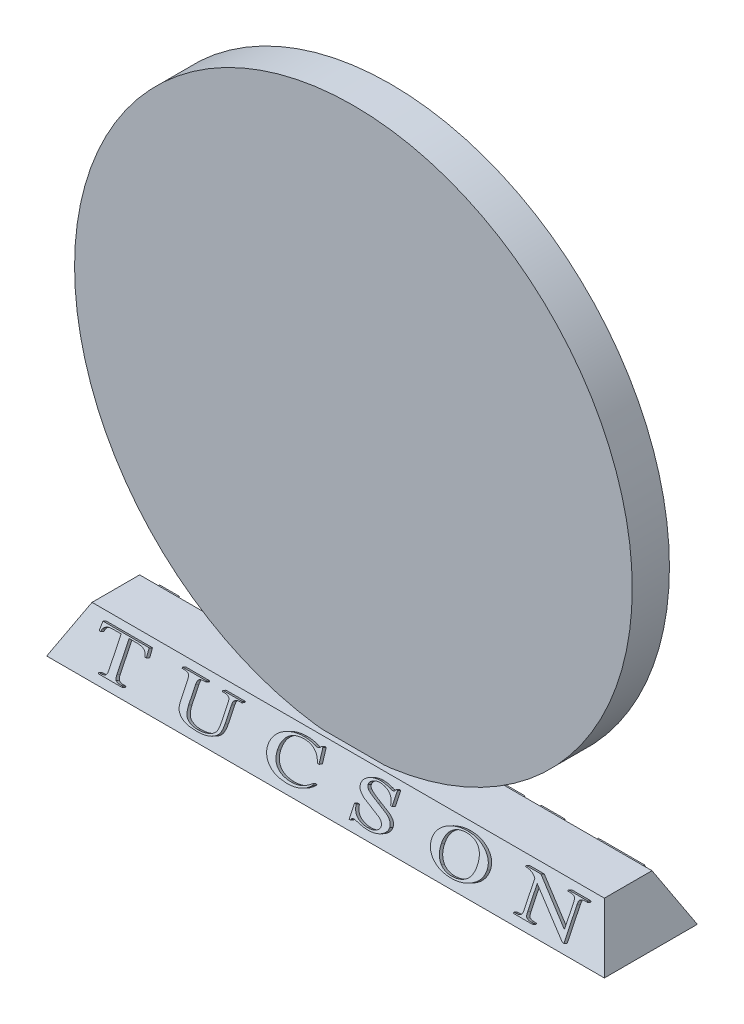
from build123d import *

# Parameters (mm, degrees)
SKETCH1_W                = 76.2
SKETCH1_H                = 12.7
BOSS_EXTRUDE1_DEPTH      = 6.35
BOSS_EXTRUDE1_TAPER      = 26
BOSS_EXTRUDE2_DEPTH      = 2.54
BOSS_EXTRUDE2_DEPTH_BACK = 2.54
SKETCH2_R                = 38.1
BOSS_EXTRUDE3_DEPTH      = 0.508
BOSS_EXTRUDE3_2_DEPTH    = 0.508
BOSS_EXTRUDE3_3_DEPTH    = 0.508
BOSS_EXTRUDE3_4_DEPTH    = 0.508
BOSS_EXTRUDE3_5_DEPTH    = 0.508
BOSS_EXTRUDE3_6_DEPTH    = 0.508
BOSS_EXTRUDE4_DEPTH      = 0.508


with BuildPart() as part:
    # Sketch1 → Boss-Extrude1 (new body)
    with BuildSketch(Plane(origin=(0, 0, 0), x_dir=(1, 0, 0), z_dir=(0, 1, 0))):
        Rectangle(SKETCH1_W, SKETCH1_H)
    extrude(amount=BOSS_EXTRUDE1_DEPTH, taper=BOSS_EXTRUDE1_TAPER)

    # Sketch8 → Boss-Extrude4 (add)
    # profile 1 of 6: a face of its own
    with BuildSketch(Plane(origin=(0, 2.501934143, 5.129725184), x_dir=(1, 0, 0), z_dir=(0, 0.43837114678907885, 0.8987940462991665))):
        with BuildLine():
            Line((-26.330077525, 3.355568512), (-26.262132587, 2.316223277))
            Line((-26.262132587, 2.316223277), (-26.476583799, 2.316223277))
            add(Edge.make_bspline(
                [(-26.476583799, 2.316223277), (-26.48695591, 2.363205895), (-26.506287456, 2.450772122), (-26.547171108, 2.569214099), (-26.590920625, 2.668014636), (-26.62968158, 2.721561212), (-26.647507786, 2.746187342)],
                knots=[0, 0, 0, 0, 1.236166905, 2.303968526, 3.219993238, 4, 4, 4, 4], degree=3))
            add(Edge.make_bspline(
                [(-26.647507786, 2.746187342), (-26.678327988, 2.779858462), (-26.740279416, 2.847540495), (-26.853599527, 2.930031307), (-26.979532282, 3.000808723), (-27.122115135, 3.05715191), (-27.282967237, 3.100914713), (-27.465097242, 3.130591923), (-27.670221517, 3.148326218), (-27.81456438, 3.150557149), (-27.890687837, 3.151733696)],
                knots=[0, 0, 0, 0, 0.80946572, 1.62710021, 2.477462409, 3.372097629, 4.344063907, 5.434924376, 6.647231883, 8, 8, 8, 8], degree=3))
            Line((-27.890687837, 3.151733696), (-28.979930137, 3.151733696))
            Line((-28.979930137, 3.151733696), (-28.979930137, -0.653182875))
            add(Edge.make_bspline(
                [(-28.979930137, -0.653182875), (-28.979685369, -0.690711234), (-28.979220678, -0.76195868), (-28.971420041, -0.863281674), (-28.960382359, -0.953835338), (-28.943944374, -1.033597793), (-28.921575017, -1.102258462), (-28.895458844, -1.1599126), (-28.86493855, -1.207781676), (-28.838577458, -1.231208614), (-28.825992385, -1.24239289)],
                knots=[0, 0, 0, 0, 1.438072626, 2.730175377, 3.892756123, 4.932971461, 5.846626079, 6.653787929, 7.357303646, 8, 8, 8, 8], degree=3))
            add(Edge.make_bspline(
                [(-28.825992385, -1.24239289), (-28.807181521, -1.255285845), (-28.768499458, -1.281798509), (-28.702663278, -1.312923857), (-28.630435326, -1.340823153), (-28.550386843, -1.362900836), (-28.46297317, -1.379422958), (-28.368741156, -1.392227189), (-28.266984289, -1.399713804), (-28.19680671, -1.400281988), (-28.160344313, -1.400577201)],
                knots=[0, 0, 0, 0, 0.786390323, 1.617108149, 2.506766951, 3.458547332, 4.47951798, 5.576975531, 6.741061174, 8, 8, 8, 8], degree=3))
            Line((-28.160344313, -1.400577201), (-27.892811117, -1.400577201))
            Line((-27.892811117, -1.400577201), (-27.892811117, -1.536467078))
            Line((-27.892811117, -1.536467078), (-31.154168177, -1.536467078))
            Line((-31.154168177, -1.536467078), (-31.154168177, -1.400577201))
            Line((-31.154168177, -1.400577201), (-30.882388422, -1.400577201))
            add(Edge.make_bspline(
                [(-30.882388422, -1.400577201), (-30.843081663, -1.400054545), (-30.767528083, -1.399049921), (-30.658750793, -1.388963785), (-30.558892878, -1.374904509), (-30.467922201, -1.353643365), (-30.385616188, -1.32626572), (-30.311875561, -1.292191584), (-30.246424438, -1.252447132), (-30.209258329, -1.219923243), (-30.191260998, -1.204173862)],
                knots=[0, 0, 0, 0, 1.282835968, 2.465806175, 3.563753624, 4.572563938, 5.51147834, 6.390179645, 7.220459982, 8, 8, 8, 8], degree=3))
            add(Edge.make_bspline(
                [(-30.191260998, -1.204173862), (-30.181292867, -1.192799883), (-30.160015723, -1.168521932), (-30.134982652, -1.122973103), (-30.113989644, -1.067848453), (-30.096302491, -1.003490899), (-30.082586962, -0.929276764), (-30.073452076, -0.845893513), (-30.068386681, -0.752686001), (-30.067510659, -0.687515651), (-30.067049157, -0.653182875)],
                knots=[0, 0, 0, 0, 0.628176643, 1.340853692, 2.147936028, 3.080883154, 4.115330297, 5.286748829, 6.57061614, 8, 8, 8, 8], degree=3))
            Line((-30.067049157, -0.653182875), (-30.067049157, 3.151733696))
            Line((-30.067049157, 3.151733696), (-30.988552389, 3.151733696))
            add(Edge.make_bspline(
                [(-30.988552389, 3.151733696), (-31.031725504, 3.151434447), (-31.114537943, 3.150860443), (-31.234183349, 3.149159974), (-31.343872805, 3.144547696), (-31.444099768, 3.139826328), (-31.534309985, 3.132017014), (-31.615129441, 3.124075771), (-31.686293656, 3.113501858), (-31.730312213, 3.104818459), (-31.75080967, 3.100774992)],
                knots=[0, 0, 0, 0, 1.354255449, 2.59766279, 3.752924816, 4.79780752, 5.744508487, 6.592775533, 7.344719018, 8, 8, 8, 8], degree=3))
            add(Edge.make_bspline(
                [(-31.75080967, 3.100774992), (-31.798267462, 3.088181482), (-31.892035218, 3.063299054), (-32.024331606, 3.005402158), (-32.1455869, 2.930859205), (-32.256427467, 2.842868875), (-32.351398478, 2.736702951), (-32.425992678, 2.61246181), (-32.477042168, 2.470104003), (-32.49380065, 2.368609665), (-32.502450555, 2.316223277)],
                knots=[0, 0, 0, 0, 1.010947277, 1.997443486, 2.963173618, 3.93827866, 4.90442188, 5.882631926, 6.907118695, 8, 8, 8, 8], degree=3))
            Line((-32.502450555, 2.316223277), (-32.716901768, 2.316223277))
            Line((-32.716901768, 2.316223277), (-32.648956829, 3.355568512))
            Line((-32.648956829, 3.355568512), (-26.330077525, 3.355568512))
        make_face()
    # profile 2 of 6: a face of its own
    with BuildSketch(Plane(origin=(0, 2.501934143, 5.129725184), x_dir=(1, 0, 0), z_dir=(0, 0.43837114678907885, 0.8987940462991665))):
        with BuildLine():
            Line((-16.27422659, 3.219678634), (-16.27422659, 3.355568512))
            Line((-16.27422659, 3.355568512), (-13.624373978, 3.355568512))
            Line((-13.624373978, 3.355568512), (-13.624373978, 3.219678634))
            Line((-13.624373978, 3.219678634), (-13.908893409, 3.219678634))
            add(Edge.make_bspline(
                [(-13.908893409, 3.219678634), (-13.945035041, 3.219325636), (-14.015400101, 3.218638374), (-14.117442411, 3.205860874), (-14.213447404, 3.189196148), (-14.302144903, 3.161427589), (-14.385763958, 3.129471507), (-14.461823681, 3.08755258), (-14.532663494, 3.039607076), (-14.573943171, 3.001197001), (-14.594712635, 2.981871349)],
                knots=[0, 0, 0, 0, 1.163096607, 2.264462275, 3.308420095, 4.296434895, 5.253118549, 6.1864314, 7.087520764, 8, 8, 8, 8], degree=3))
            add(Edge.make_bspline(
                [(-14.594712635, 2.981871349), (-14.60441093, 2.971620521), (-14.625048147, 2.949807558), (-14.647258042, 2.906958293), (-14.667851637, 2.857052986), (-14.682917875, 2.797204106), (-14.697360959, 2.729049511), (-14.704673045, 2.651111114), (-14.710274271, 2.564731346), (-14.711072964, 2.504146221), (-14.711492998, 2.472284308)],
                knots=[0, 0, 0, 0, 0.631292186, 1.343340555, 2.149496143, 3.056050789, 4.110152052, 5.277949488, 6.568464826, 8, 8, 8, 8], degree=3))
            Line((-14.711492998, 2.472284308), (-14.711492998, 0.505066003))
            add(Edge.make_bspline(
                [(-14.711492998, 0.505066003), (-14.711864153, 0.445944292), (-14.712585037, 0.331113825), (-14.725039811, 0.163944595), (-14.742823786, 0.007019468), (-14.766255448, -0.140097127), (-14.799926334, -0.276317671), (-14.838350862, -0.403039349), (-14.885471668, -0.519423905), (-14.93960221, -0.627531101), (-15.006122741, -0.727787542), (-15.083729301, -0.824377591), (-15.177261593, -0.915029048), (-15.282933294, -1.003947854), (-15.403111706, -1.088568172), (-15.537449914, -1.168650598), (-15.684427552, -1.246854977), (-15.84591991, -1.319400146), (-16.021236763, -1.388494642), (-16.212756196, -1.446117331), (-16.419227616, -1.494574469), (-16.640713802, -1.534702985), (-16.877324251, -1.566557892), (-17.129238282, -1.588032352), (-17.395856849, -1.602462605), (-17.578607489, -1.603750825), (-17.672406033, -1.604412017)],
                knots=[0, 0, 0, 0, 1.016907558, 1.975111479, 2.882102415, 3.733874962, 4.535704577, 5.294423067, 6.010074951, 6.693510313, 7.370652373, 8.076184472, 8.820973552, 9.607517709, 10.450453839, 11.346321685, 12.296815805, 13.313121745, 14.390610509, 15.536518821, 16.750395121, 18.037718219, 19.407636354, 20.856213129, 22.386420814, 24, 24, 24, 24], degree=3))
            add(Edge.make_bspline(
                [(-17.672406033, -1.604412017), (-17.774337741, -1.603651392), (-17.971915537, -1.602177045), (-18.258721232, -1.589311188), (-18.526473451, -1.568538144), (-18.775142618, -1.539023036), (-19.005314507, -1.501515601), (-19.21608271, -1.453750875), (-19.40856292, -1.399049754), (-19.582656639, -1.335139381), (-19.74107668, -1.263119565), (-19.886510165, -1.185893722), (-20.020227348, -1.102976275), (-20.141800181, -1.01330105), (-20.252310556, -0.918267182), (-20.350439041, -0.817071053), (-20.436695984, -0.710160411), (-20.485035518, -0.633853163), (-20.509107225, -0.595854333)],
                knots=[0, 0, 0, 0, 1.555685665, 3.015439928, 4.380813524, 5.65370218, 6.836446418, 7.938416537, 8.950382211, 9.88852282, 10.765991972, 11.604443534, 12.400249861, 13.165082347, 13.907934064, 14.622216493, 15.313903157, 16, 16, 16, 16], degree=3))
            add(Edge.make_bspline(
                [(-20.509107225, -0.595854333), (-20.523931111, -0.566776235), (-20.555649395, -0.504558579), (-20.591740043, -0.398444882), (-20.621988623, -0.27580127), (-20.647122561, -0.136052865), (-20.667161987, 0.020894515), (-20.68020796, 0.195241975), (-20.68882729, 0.386783796), (-20.690023036, 0.520272258), (-20.690647609, 0.589997177)],
                knots=[0, 0, 0, 0, 0.646651544, 1.383623642, 2.216014609, 3.150735899, 4.197993212, 5.3526318, 6.61720236, 8, 8, 8, 8], degree=3))
            Line((-20.690647609, 0.589997177), (-20.690647609, 2.472284308))
            add(Edge.make_bspline(
                [(-20.690647609, 2.472284308), (-20.691297569, 2.509103886), (-20.692536871, 2.579309116), (-20.700754279, 2.679748659), (-20.715248736, 2.770401477), (-20.736337784, 2.851079734), (-20.762581227, 2.922330541), (-20.795595637, 2.983628559), (-20.834716075, 3.035293651), (-20.881146633, 3.076734827), (-20.933360142, 3.110969994), (-20.991956629, 3.140936167), (-21.058472479, 3.164913964), (-21.131970461, 3.185038985), (-21.21290626, 3.20068453), (-21.30079022, 3.21242871), (-21.396196724, 3.218521731), (-21.462098025, 3.219282355), (-21.496432117, 3.219678634)],
                knots=[0, 0, 0, 0, 1.364123556, 2.601024039, 3.730484343, 4.760854803, 5.686187752, 6.536896314, 7.33149935, 8.074102754, 8.830467738, 9.639647928, 10.506668685, 11.4450072, 12.460674732, 13.5584129, 14.727951163, 16, 16, 16, 16], degree=3))
            Line((-21.496432117, 3.219678634), (-21.777766629, 3.219678634))
            Line((-21.777766629, 3.219678634), (-21.777766629, 3.355568512))
            Line((-21.777766629, 3.355568512), (-18.516409569, 3.355568512))
            Line((-18.516409569, 3.355568512), (-18.516409569, 3.219678634))
            Line((-18.516409569, 3.219678634), (-18.803052279, 3.219678634))
            add(Edge.make_bspline(
                [(-18.803052279, 3.219678634), (-18.840218454, 3.218968076), (-18.912174249, 3.217592395), (-19.016269886, 3.209880409), (-19.1116167, 3.193664361), (-19.199113291, 3.172579515), (-19.278072215, 3.145297268), (-19.349589819, 3.112634214), (-19.411720571, 3.071902446), (-19.447816533, 3.039986333), (-19.465515432, 3.024336935)],
                knots=[0, 0, 0, 0, 1.261042155, 2.441448229, 3.536804088, 4.538414734, 5.491359775, 6.366739422, 7.199164862, 8, 8, 8, 8], degree=3))
            add(Edge.make_bspline(
                [(-19.465515432, 3.024336935), (-19.476534272, 3.012268385), (-19.499892823, 2.98668458), (-19.528356534, 2.939288721), (-19.550936455, 2.88275313), (-19.57013685, 2.817656974), (-19.585961888, 2.744268072), (-19.596071559, 2.661489562), (-19.602484475, 2.570058522), (-19.603169449, 2.50591533), (-19.603528589, 2.472284308)],
                knots=[0, 0, 0, 0, 0.672697115, 1.426033086, 2.263438884, 3.177561802, 4.222250829, 5.35533648, 6.613372131, 8, 8, 8, 8], degree=3))
            Line((-19.603528589, 2.472284308), (-19.603528589, 0.317155782))
            add(Edge.make_bspline(
                [(-19.603528589, 0.317155782), (-19.602429131, 0.267574083), (-19.600138753, 0.16428601), (-19.583021189, 0.004515127), (-19.557273374, -0.166226225), (-19.523179917, -0.342679113), (-19.476216698, -0.515508686), (-19.408845043, -0.671865044), (-19.326077522, -0.80948166), (-19.222179165, -0.926914806), (-19.09760063, -1.028063019), (-18.951585158, -1.11865209), (-18.781440679, -1.198249149), (-18.588840071, -1.270870347), (-18.372373094, -1.33047474), (-18.13151964, -1.37032559), (-17.868317222, -1.396292223), (-17.684859658, -1.399112667), (-17.589598138, -1.400577201)],
                knots=[0, 0, 0, 0, 0.77630105, 1.61718215, 2.513737243, 3.479878666, 4.430592873, 5.311757024, 6.137659844, 6.934727325, 7.753516519, 8.642245342, 9.618819195, 10.690274436, 11.862555002, 13.127978344, 14.50868429, 16, 16, 16, 16], degree=3))
            add(Edge.make_bspline(
                [(-17.589598138, -1.400577201), (-17.526951498, -1.399953765), (-17.403353369, -1.398723764), (-17.220556957, -1.389327845), (-17.04283006, -1.372012697), (-16.870293938, -1.349048767), (-16.702471761, -1.318940853), (-16.539783845, -1.283305392), (-16.381666514, -1.240765082), (-16.230098509, -1.191229468), (-16.086716359, -1.136390877), (-15.953953468, -1.078423946), (-15.833129373, -1.016836689), (-15.724349121, -0.951101139), (-15.627502772, -0.880997804), (-15.542141039, -0.807621228), (-15.4677836, -0.731319738), (-15.405956063, -0.648231815), (-15.352196826, -0.556836614), (-15.308402079, -0.451543039), (-15.270223084, -0.332618589), (-15.240243596, -0.199265235), (-15.215549443, -0.052233726), (-15.199558532, 0.10914755), (-15.188399032, 0.284795256), (-15.187549344, 0.406667372), (-15.18710757, 0.470031894)],
                knots=[0, 0, 0, 0, 1.275203806, 2.515901966, 3.724396217, 4.909214312, 6.058009896, 7.19406479, 8.298435427, 9.389594311, 10.438440713, 11.42218762, 12.3371464, 13.196992875, 14.00677084, 14.767789869, 15.486156839, 16.170489972, 16.871010161, 17.639053973, 18.486499921, 19.410853267, 20.418649336, 21.519631748, 22.710391227, 24, 24, 24, 24], degree=3))
            Line((-15.18710757, 0.470031894), (-15.18710757, 2.472284308))
            add(Edge.make_bspline(
                [(-15.18710757, 2.472284308), (-15.187384044, 2.509455447), (-15.18790867, 2.579989694), (-15.195324941, 2.680695227), (-15.207778486, 2.770438633), (-15.224501852, 2.849287019), (-15.245212894, 2.917840177), (-15.272673041, 2.974876645), (-15.304230307, 3.022376975), (-15.330634428, 3.046022915), (-15.343168601, 3.057247765)],
                knots=[0, 0, 0, 0, 1.432054574, 2.717401065, 3.887966723, 4.920358629, 5.821685923, 6.638944834, 7.353900101, 8, 8, 8, 8], degree=3))
            add(Edge.make_bspline(
                [(-15.343168601, 3.057247765), (-15.361977745, 3.070475219), (-15.400617704, 3.097648611), (-15.465939058, 3.129965137), (-15.537558135, 3.157285861), (-15.615015155, 3.181200691), (-15.69948667, 3.197354315), (-15.790180401, 3.210051203), (-15.887609742, 3.219128583), (-15.955005192, 3.219491677), (-15.989707159, 3.219678634)],
                knots=[0, 0, 0, 0, 0.813472794, 1.67113161, 2.571943303, 3.52759363, 4.537905104, 5.613882455, 6.771386314, 8, 8, 8, 8], degree=3))
            Line((-15.989707159, 3.219678634), (-16.27422659, 3.219678634))
        make_face()
    # profile 3 of 6: a face of its own
    with BuildSketch(Plane(origin=(0, 2.501934143, 5.129725184), x_dir=(1, 0, 0), z_dir=(0, 0.43837114678907885, 0.8987940462991665))):
        with BuildLine():
            Line((-2.6172939, 3.423513451), (-2.413459084, 1.724889982))
            Line((-2.413459084, 1.724889982), (-2.6172939, 1.724889982))
            add(Edge.make_bspline(
                [(-2.6172939, 1.724889982), (-2.645986992, 1.789453183), (-2.702166333, 1.915864029), (-2.802450669, 2.093475176), (-2.9087418, 2.258807198), (-3.026245517, 2.409236724), (-3.152830664, 2.545487267), (-3.288097843, 2.668117037), (-3.432077814, 2.777261465), (-3.585661695, 2.87181244), (-3.747801798, 2.953206573), (-3.917235725, 3.024813094), (-4.094744451, 3.085002029), (-4.279732302, 3.135114462), (-4.47269103, 3.173497059), (-4.673877579, 3.198995802), (-4.882857311, 3.217137055), (-5.025051918, 3.218822473), (-5.097284165, 3.219678634)],
                knots=[0, 0, 0, 0, 1.095015659, 2.143974501, 3.159203782, 4.14057221, 5.099655064, 6.039853895, 6.968369381, 7.897338814, 8.832382753, 9.779220317, 10.747568227, 11.736639294, 12.74935899, 13.795558166, 14.88018408, 16, 16, 16, 16], degree=3))
            add(Edge.make_bspline(
                [(-5.097284165, 3.219678634), (-5.158161908, 3.218675394), (-5.278590778, 3.216690776), (-5.456865975, 3.2065776), (-5.630371548, 3.186991122), (-5.799881325, 3.160941121), (-5.964711206, 3.125335687), (-6.125664828, 3.084811062), (-6.281200389, 3.033915933), (-6.432696048, 2.977522755), (-6.57795731, 2.911930336), (-6.715849284, 2.837404977), (-6.845249128, 2.753422688), (-6.967543933, 2.6606966), (-7.080366414, 2.557589319), (-7.186487716, 2.446530614), (-7.28431317, 2.326345882), (-7.373538351, 2.196826324), (-7.452854823, 2.058471928), (-7.523794009, 1.912844101), (-7.58169757, 1.758324667), (-7.629523669, 1.595753901), (-7.667983438, 1.425287547), (-7.69393156, 1.246028821), (-7.710267241, 1.059194092), (-7.712187178, 0.931880088), (-7.713164307, 0.86708513)],
                knots=[0, 0, 0, 0, 1.09672334, 2.169547446, 3.214919429, 4.240928998, 5.257368913, 6.251516523, 7.229240007, 8.203632935, 9.162217257, 10.097804219, 11.024313106, 11.938459157, 12.859094327, 13.774395389, 14.703269611, 15.647481668, 16.604198975, 17.573574614, 18.562147673, 19.572653527, 20.624303844, 21.707024974, 22.833017447, 24, 24, 24, 24], degree=3))
            add(Edge.make_bspline(
                [(-7.713164307, 0.86708513), (-7.712073107, 0.813263803), (-7.7099224, 0.707184328), (-7.695070354, 0.551031497), (-7.669521473, 0.400221764), (-7.633429729, 0.255150138), (-7.587800484, 0.115143796), (-7.531394722, -0.019117282), (-7.464058794, -0.147641052), (-7.387859728, -0.271356359), (-7.300570095, -0.387997682), (-7.203313951, -0.498455995), (-7.094954624, -0.601043653), (-6.976400686, -0.696705105), (-6.848756156, -0.786407736), (-6.710213436, -0.868156081), (-6.560932814, -0.942318097), (-6.402372278, -1.009726998), (-6.235898569, -1.070274212), (-6.062862706, -1.122112052), (-5.883814228, -1.165556306), (-5.699217619, -1.201437647), (-5.509074263, -1.230340608), (-5.313154134, -1.250375902), (-5.111229247, -1.262048107), (-4.974503057, -1.26379894), (-4.905127385, -1.264687323)],
                knots=[0, 0, 0, 0, 0.974171662, 1.92004963, 2.836223785, 3.74040656, 4.623584316, 5.499180006, 6.373016646, 7.24755733, 8.126403817, 9.006789645, 9.908427597, 10.823795261, 11.762073069, 12.729906252, 13.732534892, 14.777171464, 15.847072478, 16.937335573, 18.045052947, 19.180699199, 20.340264696, 21.525154682, 22.74424893, 24, 24, 24, 24], degree=3))
            add(Edge.make_bspline(
                [(-4.905127385, -1.264687323), (-4.844958456, -1.264004491), (-4.726684234, -1.262662245), (-4.551733345, -1.254173696), (-4.382066368, -1.239528218), (-4.217810127, -1.218094619), (-4.059021966, -1.191876316), (-3.905623614, -1.158872067), (-3.757670779, -1.119529327), (-3.612893422, -1.075101699), (-3.470082131, -1.019466142), (-3.324176545, -0.95519627), (-3.175792501, -0.87696163), (-3.023806611, -0.787698522), (-2.868704962, -0.68615644), (-2.709220041, -0.573844095), (-2.547301827, -0.448356939), (-2.439742085, -0.359070481), (-2.384794813, -0.313458181)],
                knots=[0, 0, 0, 0, 1.04481012, 2.053785989, 3.040740236, 4.001109212, 4.929510517, 5.834660777, 6.724496211, 7.587423674, 8.462733612, 9.384276526, 10.354503321, 11.373626456, 12.444001022, 13.572672707, 14.759991333, 16, 16, 16, 16], degree=3))
            Line((-2.384794813, -0.313458181), (-2.209624268, -0.38140312))
            add(Edge.make_bspline(
                [(-2.209624268, -0.38140312), (-2.257593275, -0.432861035), (-2.352848882, -0.535044827), (-2.503535962, -0.678235091), (-2.660129774, -0.810602538), (-2.823250016, -0.931607998), (-2.991605531, -1.043774572), (-3.167629616, -1.142895801), (-3.347734861, -1.233939576), (-3.534987447, -1.312411898), (-3.729045006, -1.382046044), (-3.932083083, -1.4408327), (-4.143452207, -1.492073839), (-4.363868116, -1.533451198), (-4.593177624, -1.564745034), (-4.83147175, -1.588289941), (-5.078712407, -1.602269126), (-5.246603576, -1.603690061), (-5.331906531, -1.604412017)],
                knots=[0, 0, 0, 0, 0.974454152, 1.935045736, 2.877907858, 3.813347769, 4.747514893, 5.67852471, 6.610360326, 7.541886353, 8.489376858, 9.465211363, 10.468829035, 11.5015431, 12.570691614, 13.674180517, 14.818286407, 16, 16, 16, 16], degree=3))
            add(Edge.make_bspline(
                [(-5.331906531, -1.604412017), (-5.40906668, -1.603924887), (-5.560986105, -1.602965785), (-5.785431637, -1.591665507), (-6.0032398, -1.575174391), (-6.214716115, -1.550978446), (-6.419485748, -1.518331326), (-6.618293035, -1.482548067), (-6.809591347, -1.436012588), (-6.994521726, -1.384209912), (-7.17324785, -1.325966358), (-7.345251915, -1.260412384), (-7.51006175, -1.186714519), (-7.668456778, -1.107087213), (-7.82080578, -1.021174206), (-7.966377431, -0.92747253), (-8.105633098, -0.827169476), (-8.193084293, -0.754208684), (-8.236552663, -0.717942894)],
                knots=[0, 0, 0, 0, 1.193719566, 2.350296028, 3.476137714, 4.572967611, 5.64238263, 6.684035443, 7.697313522, 8.687064157, 9.654946934, 10.604679566, 11.533636029, 12.446971007, 13.346814524, 14.238340775, 15.124352118, 16, 16, 16, 16], degree=3))
            add(Edge.make_bspline(
                [(-8.236552663, -0.717942894), (-8.297413533, -0.662749704), (-8.416235784, -0.554992798), (-8.573288404, -0.378405521), (-8.706805416, -0.194990047), (-8.815297235, -0.002906263), (-8.899391257, 0.196331511), (-8.960468638, 0.40271122), (-8.997815124, 0.616594392), (-9.002002088, 0.761833401), (-9.004118143, 0.83523594)],
                knots=[0, 0, 0, 0, 1.100759498, 2.149077393, 3.161577571, 4.136576382, 5.099591615, 6.054251421, 7.016635499, 8, 8, 8, 8], degree=3))
            add(Edge.make_bspline(
                [(-9.004118143, 0.83523594), (-9.002800901, 0.894767524), (-9.000187387, 1.012882999), (-8.975798393, 1.188077587), (-8.936839912, 1.359470496), (-8.880792474, 1.526872529), (-8.81060504, 1.691156536), (-8.724352481, 1.851787559), (-8.621762664, 2.00790559), (-8.504917671, 2.160033497), (-8.373648976, 2.305223309), (-8.231009736, 2.444290367), (-8.075526495, 2.573650663), (-7.908572896, 2.694515232), (-7.73052457, 2.807782319), (-7.540174645, 2.911476021), (-7.338088952, 3.007047257), (-7.125366126, 3.093665317), (-6.904038498, 3.17051454), (-6.676793361, 3.238832512), (-6.444297721, 3.295925), (-6.206962922, 3.342765818), (-5.964637653, 3.378920809), (-5.716973993, 3.403816503), (-5.46448789, 3.420586623), (-5.294422456, 3.422533008), (-5.20875633, 3.423513451)],
                knots=[0, 0, 0, 0, 0.842894117, 1.672370066, 2.50048162, 3.329548486, 4.169441083, 5.028414836, 5.908528206, 6.812918517, 7.742938991, 8.678831237, 9.632596194, 10.605210664, 11.596759825, 12.619743043, 13.673640147, 14.76185026, 15.87161118, 16.991313384, 18.122014507, 19.261438323, 20.417012561, 21.591192802, 22.786624787, 24, 24, 24, 24], degree=3))
            add(Edge.make_bspline(
                [(-5.20875633, 3.423513451), (-5.074176504, 3.421198261), (-4.805504684, 3.416576274), (-4.404585239, 3.375024942), (-4.005885457, 3.312132617), (-3.744365239, 3.247746543), (-3.613111909, 3.215432076)],
                knots=[0, 0, 0, 0, 1.000660344, 1.99769345, 2.995070425, 4, 4, 4, 4], degree=3))
            add(Edge.make_bspline(
                [(-3.613111909, 3.215432076), (-3.577421284, 3.206021219), (-3.511924501, 3.188751113), (-3.42146927, 3.167993914), (-3.346984077, 3.1553407), (-3.302437571, 3.152831734), (-3.282941972, 3.151733696)],
                knots=[0, 0, 0, 0, 1.314361334, 2.412018278, 3.305026219, 4, 4, 4, 4], degree=3))
            add(Edge.make_bspline(
                [(-3.282941972, 3.151733696), (-3.258825124, 3.152186032), (-3.212106984, 3.153062279), (-3.144940164, 3.164327733), (-3.08213124, 3.180578336), (-3.04386142, 3.198224946), (-3.024963533, 3.206938958)],
                knots=[0, 0, 0, 0, 1.085950682, 2.103657765, 3.06357378, 4, 4, 4, 4], degree=3))
            add(Edge.make_bspline(
                [(-3.024963533, 3.206938958), (-3.002082368, 3.2202857), (-2.95727682, 3.246421088), (-2.901243865, 3.298595376), (-2.853389163, 3.356467953), (-2.831944119, 3.401036264), (-2.821128716, 3.423513451)],
                knots=[0, 0, 0, 0, 1.045928075, 2.048120483, 3.015606427, 4, 4, 4, 4], degree=3))
            Line((-2.821128716, 3.423513451), (-2.6172939, 3.423513451))
        make_face()
    # profile 4 of 6: a face of its own
    with BuildSketch(Plane(origin=(0, 2.501934143, 5.129725184), x_dir=(1, 0, 0), z_dir=(0, 0.43837114678907885, 0.8987940462991665))):
        with BuildLine():
            Line((7.574446913, 3.423513451), (7.574446913, 1.724889982))
            Line((7.574446913, 1.724889982), (7.370612097, 1.724889982))
            add(Edge.make_bspline(
                [(7.370612097, 1.724889982), (7.361788845, 1.767088396), (7.344496752, 1.849790209), (7.312646525, 1.970023106), (7.275886274, 2.083636573), (7.232942557, 2.190047712), (7.186523995, 2.290382948), (7.134377432, 2.384071202), (7.077240077, 2.471014024), (7.014702409, 2.551873642), (6.946542748, 2.627442494), (6.871952837, 2.698664558), (6.790944616, 2.76603801), (6.702179798, 2.82855331), (6.606919173, 2.887918531), (6.504734418, 2.94304782), (6.396011667, 2.99429316), (6.242453934, 3.055685126), (6.043677394, 3.121114597), (5.799539901, 3.179135735), (5.550465719, 3.212393569), (5.383317064, 3.217242744), (5.299353104, 3.219678634)],
                knots=[0, 0, 0, 0, 0.92263662, 1.808212973, 2.660948763, 3.476754273, 4.262904985, 5.025833181, 5.769530398, 6.487677364, 7.211712183, 7.945663593, 8.69340006, 9.464742128, 10.267645912, 11.094627361, 11.948506184, 12.838863883, 14.632948577, 16.422470382, 18.20289578, 20, 20, 20, 20], degree=3))
            add(Edge.make_bspline(
                [(5.299353104, 3.219678634), (5.252610646, 3.219285651), (5.160739555, 3.218513253), (5.026477491, 3.206011777), (4.898047795, 3.188441301), (4.776005742, 3.16299958), (4.659845506, 3.130347069), (4.550243674, 3.089295815), (4.44564074, 3.043689153), (4.34994098, 2.987986662), (4.262782372, 2.929343601), (4.185117837, 2.868984552), (4.120395014, 2.805487498), (4.067049989, 2.739693), (4.025626579, 2.671863469), (3.994799084, 2.602133083), (3.977566552, 2.5297292), (3.974768165, 2.480860595), (3.973365159, 2.456359713)],
                knots=[0, 0, 0, 0, 1.342871324, 2.639378777, 3.872042032, 5.066865139, 6.219428123, 7.336023725, 8.428598676, 9.49457698, 10.51291164, 11.446895529, 12.317124502, 13.112908125, 13.87516359, 14.594983493, 15.295577541, 16, 16, 16, 16], degree=3))
            add(Edge.make_bspline(
                [(3.973365159, 2.456359713), (3.976164782, 2.418705607), (3.981806618, 2.342824575), (4.03145031, 2.234130283), (4.106604895, 2.13040812), (4.175026617, 2.072769547), (4.211172445, 2.042320243)],
                knots=[0, 0, 0, 0, 0.910559074, 1.8349702, 2.856258062, 4, 4, 4, 4], degree=3))
            add(Edge.make_bspline(
                [(4.211172445, 2.042320243), (4.244416345, 2.018041149), (4.31856291, 1.963889519), (4.450438395, 1.888378104), (4.609744639, 1.803625692), (4.800432369, 1.717259847), (5.019629113, 1.622194093), (5.268664224, 1.522128657), (5.547125047, 1.415716311), (5.74333152, 1.34550266), (5.846097533, 1.308727232)],
                knots=[0, 0, 0, 0, 0.549365524, 1.225294449, 2.026456521, 2.958876662, 4.019349059, 5.217208914, 6.542472428, 8, 8, 8, 8], degree=3))
            add(Edge.make_bspline(
                [(5.846097533, 1.308727232), (5.93036892, 1.278780563), (6.09238644, 1.221206038), (6.324863803, 1.136195665), (6.537030721, 1.057047437), (6.728186131, 0.98229909), (6.899378514, 0.914657286), (7.05002761, 0.852526374), (7.179612773, 0.794824309), (7.323392804, 0.728804303), (7.479244409, 0.645325931), (7.644423357, 0.535791174), (7.786711102, 0.416933655), (7.905021947, 0.289450135), (7.999702082, 0.156773467), (8.068184035, 0.019534006), (8.109438888, -0.122127242), (8.115161116, -0.218008582), (8.118006423, -0.265684396)],
                knots=[0, 0, 0, 0, 1.467408072, 2.821192655, 4.061437082, 5.182836333, 6.188816661, 7.081660497, 7.856328907, 8.516139709, 9.677431269, 10.753180684, 11.762774002, 12.711918204, 13.599535814, 14.427897611, 15.218291466, 16, 16, 16, 16], degree=3))
            add(Edge.make_bspline(
                [(8.118006423, -0.265684396), (8.115917586, -0.310800322), (8.111772602, -0.400326101), (8.079824799, -0.531701883), (8.026822046, -0.657601026), (7.952340839, -0.778600281), (7.856523413, -0.89442264), (7.74109012, -1.006531065), (7.604090096, -1.112201774), (7.448631415, -1.212502226), (7.276640099, -1.30379795), (7.091276848, -1.385111228), (6.893472853, -1.452134623), (6.684445941, -1.509022372), (6.463009903, -1.552162117), (6.229693492, -1.582512304), (5.984400451, -1.600705782), (5.817110814, -1.603156821), (5.731440449, -1.604412017)],
                knots=[0, 0, 0, 0, 0.722328156, 1.433351715, 2.152579879, 2.903302707, 3.701193018, 4.55526867, 5.476267298, 6.468675894, 7.51630535, 8.592902795, 9.708222187, 10.859470471, 12.061539356, 13.319746352, 14.627420616, 16, 16, 16, 16], degree=3))
            add(Edge.make_bspline(
                [(5.731440449, -1.604412017), (5.62484979, -1.602977874), (5.417775787, -1.600191759), (5.211526184, -1.581589591), (5.111442883, -1.572562827)],
                knots=[0, 0, 0, 0, 1.029493391, 2, 2, 2, 2], degree=3))
            add(Edge.make_bspline(
                [(5.111442883, -1.572562827), (5.095161211, -1.570464024), (5.058677808, -1.565761098), (4.997751757, -1.557280488), (4.925175548, -1.545700288), (4.841099972, -1.530330202), (4.74541963, -1.513723598), (4.638224594, -1.493356423), (4.519320305, -1.469991533), (4.393022709, -1.444322673), (4.267303598, -1.417876763), (4.149659749, -1.395984781), (4.044560799, -1.376862063), (3.952320869, -1.360484289), (3.872255736, -1.348857643), (3.804658518, -1.340353381), (3.749450522, -1.334536076), (3.716811175, -1.333208413), (3.702647044, -1.332632262)],
                knots=[0, 0, 0, 0, 0.551072984, 1.234825133, 2.064841917, 3.017922762, 4.103816184, 5.324662701, 6.680560206, 8.171579994, 9.650960477, 10.992944535, 12.188268159, 13.237009015, 14.137482227, 14.903669003, 15.524237543, 16, 16, 16, 16], degree=3))
            add(Edge.make_bspline(
                [(3.702647044, -1.332632262), (3.680676585, -1.333196863), (3.638980066, -1.334268387), (3.579503441, -1.343529499), (3.527321491, -1.3606099), (3.480363162, -1.383934249), (3.440595071, -1.419548979), (3.408252145, -1.469074608), (3.381357477, -1.531690381), (3.368652106, -1.579080566), (3.36186071, -1.604412017)],
                knots=[0, 0, 0, 0, 1.087325076, 2.063574127, 2.966507441, 3.797042658, 4.640773436, 5.573626006, 6.70303154, 8, 8, 8, 8], degree=3))
            Line((3.36186071, -1.604412017), (3.158025894, -1.604412017))
            Line((3.158025894, -1.604412017), (3.158025894, 0.094211452))
            Line((3.158025894, 0.094211452), (3.36186071, 0.094211452))
            add(Edge.make_bspline(
                [(3.36186071, 0.094211452), (3.373707685, 0.048401788), (3.396738191, -0.040652151), (3.439252601, -0.167949515), (3.481559254, -0.287374321), (3.530157437, -0.396620669), (3.579574545, -0.49806184), (3.632793554, -0.590608881), (3.688597212, -0.674808642), (3.749465674, -0.750375877), (3.814742131, -0.820750971), (3.889099694, -0.885524665), (3.970947713, -0.947842735), (4.059735798, -1.008631558), (4.157663602, -1.065021819), (4.263286294, -1.118819863), (4.377096171, -1.16965584), (4.539847312, -1.234023679), (4.755407551, -1.30123592), (5.026321876, -1.357883576), (5.308982243, -1.394290831), (5.501658556, -1.398455799), (5.59979713, -1.400577201)],
                knots=[0, 0, 0, 0, 0.962189533, 1.870495431, 2.729060274, 3.538188589, 4.30117038, 5.023507833, 5.708319661, 6.35362748, 6.995311528, 7.658284918, 8.356584489, 9.087338085, 9.845414066, 10.653484969, 11.497685623, 12.37994521, 14.212758503, 16.082062711, 18.004421119, 20, 20, 20, 20], degree=3))
            add(Edge.make_bspline(
                [(5.59979713, -1.400577201), (5.656074296, -1.39958365), (5.765897201, -1.397644771), (5.926195057, -1.387767715), (6.077017059, -1.368053506), (6.219107694, -1.343375284), (6.351803653, -1.309447369), (6.475347535, -1.267594886), (6.590803637, -1.220703745), (6.695450186, -1.164157383), (6.789282832, -1.103058467), (6.871959021, -1.039465308), (6.941846843, -0.972469582), (6.998246711, -0.901773598), (7.044131333, -0.829745663), (7.074933814, -0.753752284), (7.095335951, -0.675487773), (7.097661503, -0.621815117), (7.098832342, -0.594792693)],
                knots=[0, 0, 0, 0, 1.449615788, 2.828874142, 4.133446532, 5.365212605, 6.541226564, 7.656627012, 8.722988033, 9.746459979, 10.714669127, 11.604365999, 12.429389614, 13.200872856, 13.929324711, 14.619901812, 15.305165774, 16, 16, 16, 16], degree=3))
            add(Edge.make_bspline(
                [(7.098832342, -0.594792693), (7.096908511, -0.564154762), (7.092979215, -0.501578853), (7.062382635, -0.408414167), (7.01176698, -0.316751807), (6.944477448, -0.223621595), (6.856415158, -0.13210224), (6.747125042, -0.044075618), (6.616246317, 0.039731928), (6.519961897, 0.090030098), (6.469280018, 0.116505885)],
                knots=[0, 0, 0, 0, 0.736883054, 1.505033989, 2.336167512, 3.251544828, 4.26417818, 5.384828319, 6.623434484, 8, 8, 8, 8], degree=3))
            add(Edge.make_bspline(
                [(6.469280018, 0.116505885), (6.447416458, 0.126940378), (6.396067202, 0.151447067), (6.305998578, 0.18852109), (6.192983532, 0.234734269), (6.056167432, 0.287304256), (5.895836968, 0.347756271), (5.712377188, 0.41592749), (5.504866709, 0.489598591), (5.281390336, 0.570415165), (5.05439383, 0.651101773), (4.838635145, 0.731048696), (4.640320179, 0.80607957), (4.459770785, 0.877085952), (4.297023427, 0.944112622), (4.151730968, 1.006351342), (4.024196726, 1.064562941), (3.880808958, 1.135176939), (3.72424698, 1.223489413), (3.558474306, 1.336136867), (3.41611638, 1.453754149), (3.297566811, 1.57716538), (3.204199039, 1.70755093), (3.138945319, 1.845299492), (3.096816842, 1.989247229), (3.092339445, 2.088036504), (3.090080955, 2.137867813)],
                knots=[0, 0, 0, 0, 0.422646419, 0.992636998, 1.698969611, 2.553258401, 3.549870739, 4.688864807, 5.968179971, 7.392042226, 8.835425655, 10.171722741, 11.406835679, 12.535134415, 13.55683409, 14.47789299, 15.292989041, 16.002687405, 17.266409723, 18.425906933, 19.495590671, 20.482708134, 21.404387764, 22.279924623, 23.132359199, 24, 24, 24, 24], degree=3))
            add(Edge.make_bspline(
                [(3.090080955, 2.137867813), (3.091883947, 2.181198396), (3.095456673, 2.267060283), (3.125299305, 2.393352358), (3.175017088, 2.514347398), (3.243636048, 2.630892601), (3.332174217, 2.741960627), (3.439354557, 2.848367662), (3.565742454, 2.950547975), (3.710089005, 3.046983261), (3.869465088, 3.135454984), (4.04076103, 3.213425812), (4.223098116, 3.277230993), (4.414910208, 3.332445822), (4.617790172, 3.37277626), (4.831108945, 3.402975083), (5.054917974, 3.419396118), (5.207674079, 3.422123158), (5.285551789, 3.423513451)],
                knots=[0, 0, 0, 0, 0.744618281, 1.475501254, 2.218126575, 2.987510222, 3.793649586, 4.654465587, 5.580393148, 6.584877271, 7.636641552, 8.712661554, 9.817762909, 10.956531709, 12.143115907, 13.372365981, 14.660386644, 16, 16, 16, 16], degree=3))
            add(Edge.make_bspline(
                [(5.285551789, 3.423513451), (5.386847586, 3.421086349), (5.592810231, 3.416151374), (5.905782533, 3.380848114), (6.227362814, 3.322375885), (6.442339706, 3.267038518), (6.552087913, 3.238788148)],
                knots=[0, 0, 0, 0, 0.946883877, 1.925279359, 2.940830956, 4, 4, 4, 4], degree=3))
            add(Edge.make_bspline(
                [(6.552087913, 3.238788148), (6.599730369, 3.225481529), (6.687169576, 3.201059611), (6.808261242, 3.175559539), (6.906057884, 3.15578979), (6.964294387, 3.152958371), (6.989483456, 3.151733696)],
                knots=[0, 0, 0, 0, 1.327535245, 2.436453482, 3.323718321, 4, 4, 4, 4], degree=3))
            add(Edge.make_bspline(
                [(6.989483456, 3.151733696), (7.012175592, 3.15221531), (7.056062121, 3.153146751), (7.118510236, 3.163853322), (7.174539484, 3.180919404), (7.225518263, 3.20417723), (7.270830714, 3.239827128), (7.309859776, 3.288708006), (7.344342127, 3.35086896), (7.361415482, 3.398082001), (7.370612097, 3.423513451)],
                knots=[0, 0, 0, 0, 1.065030334, 2.059765697, 2.964146328, 3.811748519, 4.676296362, 5.644710935, 6.731316295, 8, 8, 8, 8], degree=3))
            Line((7.370612097, 3.423513451), (7.574446913, 3.423513451))
        make_face()
    # profile 5 of 6: a face of its own
    with BuildSketch(Plane(origin=(0, 2.501934143, 5.129725184), x_dir=(1, 0, 0), z_dir=(0, 0.43837114678907885, 0.8987940462991665))):
        with BuildLine():
            add(Edge.make_bspline(
                [(17.195025585, 3.423513451), (17.317909277, 3.421746072), (17.559917635, 3.41826538), (17.916580197, 3.382609065), (18.261108647, 3.328299006), (18.593509807, 3.251091987), (18.91252351, 3.149534202), (19.219544273, 3.027698606), (19.513478508, 2.882309182), (19.747716869, 2.74458285), (19.924631508, 2.623479509), (20.050770212, 2.532168157), (20.165561879, 2.434754162), (20.274253274, 2.337345538), (20.372453018, 2.235227428), (20.462895928, 2.131126418), (20.54542486, 2.0250757), (20.61740435, 1.914774061), (20.682662957, 1.802938559), (20.737619751, 1.687141069), (20.786298924, 1.569582852), (20.823561087, 1.448050089), (20.855434718, 1.324678679), (20.875928359, 1.198151923), (20.88931813, 1.069087262), (20.890870777, 0.982130626), (20.891654909, 0.938214988)],
                knots=[0, 0, 0, 0, 1.799635561, 3.544220075, 5.245369053, 6.906496488, 8.537846876, 10.145500098, 11.740591599, 13.337383902, 14.121026305, 14.881043371, 15.617151528, 16.325405179, 17.018314392, 17.690832496, 18.345120686, 18.984955028, 19.618966435, 20.240368919, 20.86129548, 21.481052321, 22.100917561, 22.726479657, 23.356835075, 24, 24, 24, 24], degree=3))
            add(Edge.make_bspline(
                [(20.891654909, 0.938214988), (20.890821963, 0.892893896), (20.889172252, 0.803132144), (20.876515504, 0.669988278), (20.853551247, 0.540422687), (20.824360655, 0.413133703), (20.78473278, 0.289114321), (20.736932311, 0.167778132), (20.680524566, 0.049641856), (20.615254094, -0.06540208), (20.542128611, -0.177991668), (20.459774212, -0.287853489), (20.368910073, -0.394832639), (20.268149591, -0.497921652), (20.160046926, -0.598897713), (20.043010875, -0.69660751), (19.917198647, -0.790999611), (19.738772455, -0.914503334), (19.501630136, -1.055332577), (19.20193809, -1.202492209), (18.887686153, -1.326786462), (18.559116605, -1.428855967), (18.215811865, -1.507207017), (17.858252643, -1.563001369), (17.485894922, -1.597777516), (17.232613741, -1.602174493), (17.103724573, -1.604412017)],
                knots=[0, 0, 0, 0, 0.646944816, 1.28132176, 1.906704016, 2.524284087, 3.14419454, 3.763342914, 4.384733654, 5.011338954, 5.650285586, 6.299946603, 6.970085197, 7.65245099, 8.35660967, 9.081044147, 9.827701486, 10.601219499, 12.178025601, 13.759526451, 15.362735797, 16.997339326, 18.666419033, 20.384807608, 22.160308876, 24, 24, 24, 24], degree=3))
            add(Edge.make_bspline(
                [(17.103724573, -1.604412017), (16.973760951, -1.602697357), (16.718677981, -1.599331948), (16.344468082, -1.563321903), (15.985481274, -1.511082525), (15.643038881, -1.43267316), (15.315307864, -1.334697182), (15.004496791, -1.211971681), (14.708394045, -1.069775912), (14.476007923, -0.931958655), (14.301895792, -0.810753876), (14.177907261, -0.719378565), (14.064483613, -0.621717131), (13.957923113, -0.522772953), (13.861187756, -0.418881557), (13.771757397, -0.312954114), (13.690668648, -0.203742572), (13.619625783, -0.090351795), (13.555616865, 0.025278874), (13.499956856, 0.14423148), (13.454784904, 0.267096036), (13.415914158, 0.392703881), (13.386576848, 0.521944272), (13.36518141, 0.654536833), (13.352205229, 0.790032673), (13.350582685, 0.881566291), (13.349766707, 0.927598591)],
                knots=[0, 0, 0, 0, 1.861885825, 3.654371582, 5.382885236, 7.057307406, 8.684089137, 10.280356626, 11.840866107, 13.387261655, 14.145495984, 14.880845519, 15.59318885, 16.289206352, 16.963718439, 17.626033168, 18.275189119, 18.911136447, 19.542130586, 20.168358268, 20.791002652, 21.416655097, 22.051448787, 22.688426546, 23.340409096, 24, 24, 24, 24], degree=3))
            add(Edge.make_bspline(
                [(13.349766707, 0.927598591), (13.350956315, 0.974693946), (13.353313672, 1.06801929), (13.366997349, 1.20650005), (13.391282145, 1.341831444), (13.427078444, 1.473447582), (13.469991244, 1.602751527), (13.524702754, 1.727568069), (13.587620795, 1.849897856), (13.660788686, 1.968400057), (13.744400209, 2.08387463), (13.837569589, 2.195708947), (13.940063109, 2.304893378), (14.052930199, 2.409675621), (14.175205419, 2.511723961), (14.307192934, 2.610324932), (14.448584696, 2.706519206), (14.548383294, 2.765819735), (14.599316596, 2.796084407)],
                knots=[0, 0, 0, 0, 0.956554107, 1.895531767, 2.823135845, 3.745350645, 4.663551954, 5.587445545, 6.509996348, 7.455442987, 8.412914652, 9.40306085, 10.409762365, 11.452183298, 12.528827791, 13.642821962, 14.796988481, 16, 16, 16, 16], degree=3))
            add(Edge.make_bspline(
                [(14.599316596, 2.796084407), (14.691289433, 2.846749745), (14.876021664, 2.948513715), (15.1687013, 3.075264172), (15.473985964, 3.182425404), (15.792518012, 3.270564021), (16.124381783, 3.339828499), (16.469878018, 3.387636595), (16.828194184, 3.418565458), (17.071455964, 3.421846686), (17.195025585, 3.423513451)],
                knots=[0, 0, 0, 0, 0.93249031, 1.872955346, 2.829542414, 3.80516078, 4.80716595, 5.839166372, 6.902361934, 8, 8, 8, 8], degree=3))
        make_face()
        with BuildLine():
            add(Edge.make_bspline(
                [(17.086738338, 3.219678634), (17.002457382, 3.218406406), (16.837449078, 3.215915591), (16.596596875, 3.191959196), (16.368430846, 3.154074067), (16.152987887, 3.101467973), (15.950643383, 3.032118851), (15.76078905, 2.948560637), (15.583962132, 2.848490363), (15.475873877, 2.76954653), (15.422087339, 2.730262747)],
                knots=[0, 0, 0, 0, 1.14416388, 2.240085428, 3.282875966, 4.282847232, 5.247810323, 6.183617364, 7.096137375, 8, 8, 8, 8], degree=3))
            add(Edge.make_bspline(
                [(15.422087339, 2.730262747), (15.359872153, 2.677916989), (15.236612362, 2.574210359), (15.076367099, 2.394086862), (14.941817765, 2.195542821), (14.830234433, 1.979905944), (14.746103318, 1.745378362), (14.683994377, 1.494381123), (14.648174471, 1.225533355), (14.643249125, 1.040591976), (14.640720543, 0.945646465)],
                knots=[0, 0, 0, 0, 0.964676499, 1.911202588, 2.851898028, 3.806747345, 4.786619825, 5.803884315, 6.872554497, 8, 8, 8, 8], degree=3))
            add(Edge.make_bspline(
                [(14.640720543, 0.945646465), (14.642989637, 0.848186629), (14.647414298, 0.658143009), (14.686966383, 0.381951475), (14.748103624, 0.122207098), (14.838460983, -0.119295532), (14.952249971, -0.344311676), (15.092431839, -0.551407353), (15.25775634, -0.741875698), (15.385928137, -0.851481247), (15.45075161, -0.906914755)],
                knots=[0, 0, 0, 0, 1.115706787, 2.175593185, 3.189150965, 4.166415031, 5.121720843, 6.070538348, 7.024165926, 8, 8, 8, 8], degree=3))
            add(Edge.make_bspline(
                [(15.45075161, -0.906914755), (15.503739076, -0.946683233), (15.610276715, -1.026642515), (15.786314262, -1.125753306), (15.973568168, -1.210810418), (16.173087269, -1.281236745), (16.385231907, -1.335274602), (16.610057802, -1.372695207), (16.846987092, -1.396855462), (17.009177504, -1.399318662), (17.092046537, -1.400577201)],
                knots=[0, 0, 0, 0, 0.909424037, 1.828505809, 2.768492924, 3.73267678, 4.731507766, 5.772239541, 6.861755446, 8, 8, 8, 8], degree=3))
            add(Edge.make_bspline(
                [(17.092046537, -1.400577201), (17.180929636, -1.39899828), (17.355181091, -1.395902875), (17.610358148, -1.370126843), (17.853592406, -1.327287206), (18.08567603, -1.270122106), (18.304977135, -1.192536381), (18.513409551, -1.101092961), (18.70810712, -0.988938223), (18.892293513, -0.864040602), (19.060491158, -0.719968402), (19.20568393, -0.553746616), (19.329057832, -0.368243483), (19.42882537, -0.162715798), (19.50647216, 0.06188015), (19.560682792, 0.305869003), (19.595717726, 0.56880978), (19.599005593, 0.750893979), (19.600701072, 0.844790697)],
                knots=[0, 0, 0, 0, 1.114044401, 2.184035658, 3.210930248, 4.208319272, 5.176380878, 6.123625499, 7.05738422, 7.988874548, 8.910328288, 9.825094331, 10.746644174, 11.694989265, 12.681266962, 13.718686256, 14.82357791, 16, 16, 16, 16], degree=3))
            add(Edge.make_bspline(
                [(19.600701072, 0.844790697), (19.599966492, 0.896462932), (19.598516474, 0.998460794), (19.590740405, 1.148773876), (19.573981618, 1.293857944), (19.553361598, 1.434285937), (19.525519103, 1.569511633), (19.493107134, 1.700275069), (19.452213713, 1.825018292), (19.407107911, 1.945556555), (19.354300219, 2.060272872), (19.297737919, 2.171384365), (19.232402166, 2.276047353), (19.162194183, 2.376605889), (19.085735444, 2.471801704), (19.003837868, 2.562911068), (18.914673511, 2.647596742), (18.85114931, 2.699847347), (18.819334277, 2.726016189)],
                knots=[0, 0, 0, 0, 1.174586193, 2.31856201, 3.419099631, 4.492947992, 5.543529821, 6.556009914, 7.553133634, 8.525621856, 9.47953809, 10.422094322, 11.357415649, 12.281253374, 13.20830689, 14.130813082, 15.063848997, 16, 16, 16, 16], degree=3))
            add(Edge.make_bspline(
                [(18.819334277, 2.726016189), (18.765285628, 2.765807447), (18.656326652, 2.846024343), (18.475496098, 2.945560927), (18.28064438, 3.030457925), (18.070728306, 3.100582804), (17.845847715, 3.154539995), (17.605832887, 3.191968329), (17.351222579, 3.215975624), (17.17632631, 3.218424325), (17.086738338, 3.219678634)],
                knots=[0, 0, 0, 0, 0.876997168, 1.767975998, 2.692336229, 3.653905443, 4.658582616, 5.713178816, 6.828610396, 8, 8, 8, 8], degree=3))
        make_face(mode=Mode.SUBTRACT)
    # profile 6 of 6: a face of its own
    with BuildSketch(Plane(origin=(0, 2.501934143, 5.129725184), x_dir=(1, 0, 0), z_dir=(0, 0.43837114678907885, 0.8987940462991665))):
        with BuildLine():
            Line((25.161569653, 3.355568512), (27.193547978, 3.355568512))
            Line((27.193547978, 3.355568512), (32.034624864, -0.363355245))
            Line((32.034624864, -0.363355245), (32.034624864, 2.472284308))
            add(Edge.make_bspline(
                [(32.034624864, 2.472284308), (32.034337256, 2.509807141), (32.033791233, 2.581044096), (32.026531722, 2.682484697), (32.013718553, 2.772857272), (31.99756111, 2.852670299), (31.975425124, 2.92162228), (31.948006629, 2.979093693), (31.916422879, 3.02697932), (31.889380036, 3.050324231), (31.876440554, 3.061494324)],
                knots=[0, 0, 0, 0, 1.433577354, 2.72164112, 3.882400641, 4.91936437, 5.830162994, 6.640575511, 7.34954141, 8, 8, 8, 8], degree=3))
            add(Edge.make_bspline(
                [(31.876440554, 3.061494324), (31.857985383, 3.074378169), (31.820038215, 3.100869685), (31.755001847, 3.132290444), (31.683283991, 3.159676186), (31.603725104, 3.182208408), (31.516933678, 3.198373707), (31.422749072, 3.211495193), (31.320964604, 3.218755605), (31.250437834, 3.219364073), (31.213977401, 3.219678634)],
                knots=[0, 0, 0, 0, 0.779365089, 1.60251561, 2.495843588, 3.439738805, 4.464920191, 5.554744402, 6.735868996, 8, 8, 8, 8], degree=3))
            Line((31.213977401, 3.219678634), (30.947505844, 3.219678634))
            Line((30.947505844, 3.219678634), (30.947505844, 3.355568512))
            Line((30.947505844, 3.355568512), (33.597358456, 3.355568512))
            Line((33.597358456, 3.355568512), (33.597358456, 3.219678634))
            Line((33.597358456, 3.219678634), (33.325578701, 3.219678634))
            add(Edge.make_bspline(
                [(33.325578701, 3.219678634), (33.286271941, 3.219155978), (33.210718362, 3.218151354), (33.101941071, 3.208065218), (33.002083157, 3.194005943), (32.91111248, 3.172744798), (32.828806466, 3.145367154), (32.755065839, 3.111293017), (32.689614717, 3.071548565), (32.652448608, 3.039024676), (32.634451277, 3.023275296)],
                knots=[0, 0, 0, 0, 1.282835968, 2.465806175, 3.563753624, 4.572563938, 5.51147834, 6.390179645, 7.220459982, 8, 8, 8, 8], degree=3))
            add(Edge.make_bspline(
                [(32.634451277, 3.023275296), (32.624483146, 3.011901317), (32.603206001, 2.987623366), (32.578172931, 2.942074536), (32.557179923, 2.886949886), (32.53949277, 2.822592333), (32.525777241, 2.748378197), (32.516642355, 2.664994947), (32.51157696, 2.571787435), (32.510700938, 2.506617085), (32.510239436, 2.472284308)],
                knots=[0, 0, 0, 0, 0.628176643, 1.340853692, 2.147936028, 3.080883154, 4.115330297, 5.286748829, 6.57061614, 8, 8, 8, 8], degree=3))
            Line((32.510239436, 2.472284308), (32.510239436, -1.615028414))
            Line((32.510239436, -1.615028414), (32.315959376, -1.615028414))
            Line((32.315959376, -1.615028414), (27.142589274, 2.314099998))
            Line((27.142589274, 2.314099998), (27.142589274, -0.653182875))
            add(Edge.make_bspline(
                [(27.142589274, -0.653182875), (27.142829899, -0.690712562), (27.143286724, -0.76196253), (27.151140022, -0.863268641), (27.162007089, -0.953877004), (27.178960834, -1.033361211), (27.199619303, -1.1024557), (27.226065972, -1.159891087), (27.256505019, -1.207786233), (27.282875724, -1.231210087), (27.295465386, -1.24239289)],
                knots=[0, 0, 0, 0, 1.438816787, 2.731588165, 3.894770512, 4.935524133, 5.84551177, 6.653091303, 7.356971069, 8, 8, 8, 8], degree=3))
            add(Edge.make_bspline(
                [(27.295465386, -1.24239289), (27.314276205, -1.255286063), (27.352958176, -1.281799175), (27.418795098, -1.312920935), (27.49101993, -1.340835309), (27.570745938, -1.362758297), (27.657411215, -1.379449169), (27.750939982, -1.392289677), (27.85199791, -1.399678325), (27.92182056, -1.400270806), (27.957928539, -1.400577201)],
                knots=[0, 0, 0, 0, 0.789976735, 1.624483132, 2.518199312, 3.474320382, 4.487901083, 5.578198886, 6.747593457, 8, 8, 8, 8], degree=3))
            Line((27.957928539, -1.400577201), (28.229708294, -1.400577201))
            Line((28.229708294, -1.400577201), (28.229708294, -1.536467078))
            Line((28.229708294, -1.536467078), (25.579855683, -1.536467078))
            Line((25.579855683, -1.536467078), (25.579855683, -1.400577201))
            Line((25.579855683, -1.400577201), (25.846327239, -1.400577201))
            add(Edge.make_bspline(
                [(25.846327239, -1.400577201), (25.885987749, -1.400054284), (25.962247609, -1.399048811), (26.072082903, -1.388956411), (26.173003009, -1.3749093), (26.265008318, -1.353598868), (26.348131273, -1.326489201), (26.422141357, -1.292171568), (26.487600995, -1.25245167), (26.524766044, -1.219924723), (26.542762862, -1.204173862)],
                knots=[0, 0, 0, 0, 1.285277259, 2.471351603, 3.572921528, 4.58580381, 5.528987772, 6.401506466, 7.225944886, 8, 8, 8, 8], degree=3))
            add(Edge.make_bspline(
                [(26.542762862, -1.204173862), (26.552730992, -1.192799883), (26.574008137, -1.168521932), (26.599041207, -1.122973103), (26.620034216, -1.067848453), (26.637721368, -1.003490899), (26.651436898, -0.929276764), (26.660571784, -0.845893513), (26.665637179, -0.752686001), (26.666513201, -0.687515651), (26.666974703, -0.653182875)],
                knots=[0, 0, 0, 0, 0.628176643, 1.340853692, 2.147936028, 3.080883154, 4.115330297, 5.286748829, 6.57061614, 8, 8, 8, 8], degree=3))
            Line((26.666974703, -0.653182875), (26.666974703, 2.676119124))
            add(Edge.make_bspline(
                [(26.666974703, 2.676119124), (26.615254455, 2.717204161), (26.519689682, 2.793117993), (26.383447652, 2.892471194), (26.267629866, 2.969323817), (26.165146641, 3.027523153), (26.06159544, 3.071550807), (25.944952261, 3.110869602), (25.808412384, 3.150694263), (25.709876711, 3.172840286), (25.657355378, 3.184644525)],
                knots=[0, 0, 0, 0, 1.383700568, 2.556697552, 3.531378718, 4.294675406, 5.021869852, 5.884677365, 6.872493969, 8, 8, 8, 8], degree=3))
            add(Edge.make_bspline(
                [(25.657355378, 3.184644525), (25.626616832, 3.189938489), (25.558356865, 3.2016946), (25.444902339, 3.212765232), (25.3102647, 3.218628191), (25.21359668, 3.219311094), (25.161569653, 3.219678634)],
                knots=[0, 0, 0, 0, 0.751807196, 1.66951078, 2.74572353, 4, 4, 4, 4], degree=3))
            Line((25.161569653, 3.219678634), (25.161569653, 3.355568512))
        make_face()
    extrude(amount=BOSS_EXTRUDE4_DEPTH)


with BuildPart() as body_2:
    # Sketch2 → Boss-Extrude2 (new, two sides: drawn at the far end of the back side and taken through both)
    with BuildSketch(Plane.XY.offset(-BOSS_EXTRUDE2_DEPTH_BACK)):
        with Locations((0, 44.196)):
            Circle(SKETCH2_R)
    extrude(amount=BOSS_EXTRUDE2_DEPTH + BOSS_EXTRUDE2_DEPTH_BACK)


with BuildPart() as body_3:
    # Sketch3 → Boss-Extrude3 (new body)
    with BuildSketch(Plane(origin=(0, 2.501934143, -5.129725184), x_dir=(-1, 0, 0), z_dir=(0, 0.4383711467890788, -0.8987940462991663))):
        with BuildLine():
            Line((-26.706860243, 3.184234786), (-26.638915304, 2.144889551))
            Line((-26.638915304, 2.144889551), (-26.853366517, 2.144889551))
            add(Edge.make_bspline(
                [(-26.853366517, 2.144889551), (-26.863738628, 2.191872169), (-26.883070174, 2.279438396), (-26.923953826, 2.397880372), (-26.967703343, 2.496680909), (-27.006464298, 2.550227486), (-27.024290504, 2.574853616)],
                knots=[0, 0, 0, 0, 1.236166905, 2.303968526, 3.219993238, 4, 4, 4, 4], degree=3))
            add(Edge.make_bspline(
                [(-27.024290504, 2.574853616), (-27.055110706, 2.608524736), (-27.117062134, 2.676206769), (-27.230382245, 2.75869758), (-27.356315, 2.829474996), (-27.498897853, 2.885818184), (-27.659749955, 2.929580987), (-27.84187996, 2.959258196), (-28.047004234, 2.976992491), (-28.191347098, 2.979223422), (-28.267470555, 2.980399969)],
                knots=[0, 0, 0, 0, 0.80946572, 1.62710021, 2.477462409, 3.372097629, 4.344063907, 5.434924376, 6.647231883, 8, 8, 8, 8], degree=3))
            Line((-28.267470555, 2.980399969), (-29.356712855, 2.980399969))
            Line((-29.356712855, 2.980399969), (-29.356712855, -0.824516601))
            add(Edge.make_bspline(
                [(-29.356712855, -0.824516601), (-29.356468087, -0.86204496), (-29.356003396, -0.933292407), (-29.348202759, -1.0346154), (-29.337165077, -1.125169064), (-29.320727092, -1.204931519), (-29.298357735, -1.273592188), (-29.272241562, -1.331246327), (-29.241721268, -1.379115402), (-29.215360176, -1.40254234), (-29.202775103, -1.413726617)],
                knots=[0, 0, 0, 0, 1.438072626, 2.730175377, 3.892756123, 4.932971461, 5.846626079, 6.653787929, 7.357303646, 8, 8, 8, 8], degree=3))
            add(Edge.make_bspline(
                [(-29.202775103, -1.413726617), (-29.183964239, -1.426619571), (-29.145282176, -1.453132235), (-29.079445996, -1.484257583), (-29.007218044, -1.512156879), (-28.927169561, -1.534234562), (-28.839755888, -1.550756685), (-28.745523874, -1.563560915), (-28.643767007, -1.57104753), (-28.573589428, -1.571615714), (-28.537127031, -1.571910927)],
                knots=[0, 0, 0, 0, 0.786390323, 1.617108149, 2.506766951, 3.458547332, 4.47951798, 5.576975531, 6.741061174, 8, 8, 8, 8], degree=3))
            Line((-28.537127031, -1.571910927), (-28.269593835, -1.571910927))
            Line((-28.269593835, -1.571910927), (-28.269593835, -1.707800805))
            Line((-28.269593835, -1.707800805), (-31.530950895, -1.707800805))
            Line((-31.530950895, -1.707800805), (-31.530950895, -1.571910927))
            Line((-31.530950895, -1.571910927), (-31.25917114, -1.571910927))
            add(Edge.make_bspline(
                [(-31.25917114, -1.571910927), (-31.219864381, -1.571388271), (-31.144310801, -1.570383647), (-31.035533511, -1.560297511), (-30.935675596, -1.546238235), (-30.844704919, -1.524977091), (-30.762398905, -1.497599447), (-30.688658279, -1.46352531), (-30.623207156, -1.423780858), (-30.586041047, -1.391256969), (-30.568043716, -1.375507589)],
                knots=[0, 0, 0, 0, 1.282835968, 2.465806175, 3.563753624, 4.572563938, 5.51147834, 6.390179645, 7.220459982, 8, 8, 8, 8], degree=3))
            add(Edge.make_bspline(
                [(-30.568043716, -1.375507589), (-30.558075585, -1.36413361), (-30.536798441, -1.339855659), (-30.51176537, -1.294306829), (-30.490772362, -1.239182179), (-30.473085209, -1.174824626), (-30.45936968, -1.10061049), (-30.450234794, -1.017227239), (-30.445169399, -0.924019727), (-30.444293377, -0.858849377), (-30.443831875, -0.824516601)],
                knots=[0, 0, 0, 0, 0.628176643, 1.340853692, 2.147936028, 3.080883154, 4.115330297, 5.286748829, 6.57061614, 8, 8, 8, 8], degree=3))
            Line((-30.443831875, -0.824516601), (-30.443831875, 2.980399969))
            Line((-30.443831875, 2.980399969), (-31.365335107, 2.980399969))
            add(Edge.make_bspline(
                [(-31.365335107, 2.980399969), (-31.408508222, 2.98010072), (-31.49132066, 2.979526717), (-31.610966067, 2.977826248), (-31.720655523, 2.97321397), (-31.820882486, 2.968492601), (-31.911092703, 2.960683288), (-31.991912159, 2.952742045), (-32.063076374, 2.942168131), (-32.107094931, 2.933484733), (-32.127592388, 2.929441265)],
                knots=[0, 0, 0, 0, 1.354255449, 2.59766279, 3.752924816, 4.79780752, 5.744508487, 6.592775533, 7.344719018, 8, 8, 8, 8], degree=3))
            add(Edge.make_bspline(
                [(-32.127592388, 2.929441265), (-32.17505018, 2.916847756), (-32.268817936, 2.891965327), (-32.401114324, 2.834068432), (-32.522369618, 2.759525478), (-32.633210185, 2.671535149), (-32.728181196, 2.565369225), (-32.802775395, 2.441128083), (-32.853824885, 2.298770277), (-32.870583368, 2.197275938), (-32.879233273, 2.144889551)],
                knots=[0, 0, 0, 0, 1.010947277, 1.997443486, 2.963173618, 3.93827866, 4.90442188, 5.882631926, 6.907118695, 8, 8, 8, 8], degree=3))
            Line((-32.879233273, 2.144889551), (-33.093684486, 2.144889551))
            Line((-33.093684486, 2.144889551), (-33.025739547, 3.184234786))
            Line((-33.025739547, 3.184234786), (-26.706860243, 3.184234786))
        make_face()
    extrude(amount=BOSS_EXTRUDE3_DEPTH)


with BuildPart() as body_4:
    # Sketch3 → Boss-Extrude3 2 (new body)
    with BuildSketch(Plane(origin=(0, 2.501934143, -5.129725184), x_dir=(-1, 0, 0), z_dir=(0, 0.4383711467890788, -0.8987940462991663))):
        with BuildLine():
            Line((-16.651009308, 3.048344908), (-16.651009308, 3.184234786))
            Line((-16.651009308, 3.184234786), (-14.001156696, 3.184234786))
            Line((-14.001156696, 3.184234786), (-14.001156696, 3.048344908))
            Line((-14.001156696, 3.048344908), (-14.285676127, 3.048344908))
            add(Edge.make_bspline(
                [(-14.285676127, 3.048344908), (-14.321817759, 3.04799191), (-14.392182819, 3.047304648), (-14.494225129, 3.034527148), (-14.590230122, 3.017862421), (-14.678927621, 2.990093863), (-14.762546676, 2.958137781), (-14.838606399, 2.916218854), (-14.909446212, 2.86827335), (-14.950725889, 2.829863275), (-14.971495353, 2.810537622)],
                knots=[0, 0, 0, 0, 1.163096607, 2.264462275, 3.308420095, 4.296434895, 5.253118549, 6.1864314, 7.087520764, 8, 8, 8, 8], degree=3))
            add(Edge.make_bspline(
                [(-14.971495353, 2.810537622), (-14.981193648, 2.800286795), (-15.001830865, 2.778473832), (-15.02404076, 2.735624566), (-15.044634355, 2.68571926), (-15.059700593, 2.62587038), (-15.074143677, 2.557715785), (-15.081455763, 2.479777387), (-15.087056989, 2.39339762), (-15.087855682, 2.332812495), (-15.088275716, 2.300950582)],
                knots=[0, 0, 0, 0, 0.631292186, 1.343340555, 2.149496143, 3.056050789, 4.110152052, 5.277949488, 6.568464826, 8, 8, 8, 8], degree=3))
            Line((-15.088275716, 2.300950582), (-15.088275716, 0.333732277))
            add(Edge.make_bspline(
                [(-15.088275716, 0.333732277), (-15.088646871, 0.274610566), (-15.089367755, 0.159780099), (-15.101822529, -0.007389132), (-15.119606504, -0.164314258), (-15.143038166, -0.311430853), (-15.176709052, -0.447651397), (-15.21513358, -0.574373075), (-15.262254386, -0.690757631), (-15.316384928, -0.798864828), (-15.382905459, -0.899121268), (-15.460512019, -0.995711317), (-15.554044311, -1.086362774), (-15.659716012, -1.17528158), (-15.779894424, -1.259901899), (-15.914232632, -1.339984324), (-16.06121027, -1.418188703), (-16.222702628, -1.490733873), (-16.398019481, -1.559828369), (-16.589538914, -1.617451057), (-16.796010334, -1.665908195), (-17.01749652, -1.706036712), (-17.254106969, -1.737891618), (-17.506021, -1.759366079), (-17.772639567, -1.773796331), (-17.955390207, -1.775084552), (-18.04918875, -1.775745743)],
                knots=[0, 0, 0, 0, 1.016907558, 1.975111479, 2.882102415, 3.733874962, 4.535704577, 5.294423067, 6.010074951, 6.693510313, 7.370652373, 8.076184472, 8.820973552, 9.607517709, 10.450453839, 11.346321685, 12.296815805, 13.313121745, 14.390610509, 15.536518821, 16.750395121, 18.037718219, 19.407636354, 20.856213129, 22.386420814, 24, 24, 24, 24], degree=3))
            add(Edge.make_bspline(
                [(-18.04918875, -1.775745743), (-18.151120459, -1.774985118), (-18.348698255, -1.773510772), (-18.63550395, -1.760644914), (-18.903256169, -1.73987187), (-19.151925336, -1.710356762), (-19.382097225, -1.672849328), (-19.592865428, -1.625084601), (-19.785345638, -1.57038348), (-19.959439357, -1.506473108), (-20.117859398, -1.434453291), (-20.263292883, -1.357227448), (-20.397010066, -1.274310001), (-20.518582899, -1.184634776), (-20.629093274, -1.089600909), (-20.727221759, -0.988404779), (-20.813478702, -0.881494137), (-20.861818236, -0.805186889), (-20.885889943, -0.767188059)],
                knots=[0, 0, 0, 0, 1.555685665, 3.015439928, 4.380813524, 5.65370218, 6.836446418, 7.938416537, 8.950382211, 9.88852282, 10.765991972, 11.604443534, 12.400249861, 13.165082347, 13.907934064, 14.622216493, 15.313903157, 16, 16, 16, 16], degree=3))
            add(Edge.make_bspline(
                [(-20.885889943, -0.767188059), (-20.900713829, -0.738109961), (-20.932432113, -0.675892305), (-20.968522761, -0.569778609), (-20.998771341, -0.447134996), (-21.023905279, -0.307386591), (-21.043944705, -0.150439211), (-21.056990678, 0.023908249), (-21.065610008, 0.215450069), (-21.066805754, 0.348938532), (-21.067430327, 0.41866345)],
                knots=[0, 0, 0, 0, 0.646651544, 1.383623642, 2.216014609, 3.150735899, 4.197993212, 5.3526318, 6.61720236, 8, 8, 8, 8], degree=3))
            Line((-21.067430327, 0.41866345), (-21.067430327, 2.300950582))
            add(Edge.make_bspline(
                [(-21.067430327, 2.300950582), (-21.068080287, 2.33777016), (-21.069319589, 2.40797539), (-21.077536997, 2.508414932), (-21.092031454, 2.599067751), (-21.113120502, 2.679746008), (-21.139363945, 2.750996815), (-21.172378355, 2.812294833), (-21.211498793, 2.863959925), (-21.257929351, 2.9054011), (-21.31014286, 2.939636268), (-21.368739347, 2.969602441), (-21.435255197, 2.993580238), (-21.508753179, 3.013705259), (-21.589688978, 3.029350804), (-21.677572938, 3.041094984), (-21.772979442, 3.047188005), (-21.838880743, 3.047948629), (-21.873214835, 3.048344908)],
                knots=[0, 0, 0, 0, 1.364123556, 2.601024039, 3.730484343, 4.760854803, 5.686187752, 6.536896314, 7.33149935, 8.074102754, 8.830467738, 9.639647928, 10.506668685, 11.4450072, 12.460674732, 13.5584129, 14.727951163, 16, 16, 16, 16], degree=3))
            Line((-21.873214835, 3.048344908), (-22.154549347, 3.048344908))
            Line((-22.154549347, 3.048344908), (-22.154549347, 3.184234786))
            Line((-22.154549347, 3.184234786), (-18.893192287, 3.184234786))
            Line((-18.893192287, 3.184234786), (-18.893192287, 3.048344908))
            Line((-18.893192287, 3.048344908), (-19.179834997, 3.048344908))
            add(Edge.make_bspline(
                [(-19.179834997, 3.048344908), (-19.217001172, 3.04763435), (-19.288956967, 3.046258668), (-19.393052604, 3.038546683), (-19.488399418, 3.022330635), (-19.575896009, 3.001245788), (-19.654854933, 2.973963542), (-19.726372537, 2.941300488), (-19.788503289, 2.900568719), (-19.82459925, 2.868652607), (-19.84229815, 2.853003209)],
                knots=[0, 0, 0, 0, 1.261042155, 2.441448229, 3.536804088, 4.538414734, 5.491359775, 6.366739422, 7.199164862, 8, 8, 8, 8], degree=3))
            add(Edge.make_bspline(
                [(-19.84229815, 2.853003209), (-19.85331699, 2.840934659), (-19.876675541, 2.815350854), (-19.905139252, 2.767954995), (-19.927719173, 2.711419404), (-19.946919568, 2.646323248), (-19.962744606, 2.572934346), (-19.972854277, 2.490155836), (-19.979267193, 2.398724796), (-19.979952167, 2.334581604), (-19.980311307, 2.300950582)],
                knots=[0, 0, 0, 0, 0.672697115, 1.426033086, 2.263438884, 3.177561802, 4.222250829, 5.35533648, 6.613372131, 8, 8, 8, 8], degree=3))
            Line((-19.980311307, 2.300950582), (-19.980311307, 0.145822056))
            add(Edge.make_bspline(
                [(-19.980311307, 0.145822056), (-19.979211849, 0.096240356), (-19.976921471, -0.007047716), (-19.959803907, -0.166818599), (-19.934056092, -0.337559951), (-19.899962635, -0.514012839), (-19.852999416, -0.686842412), (-19.785627761, -0.84319877), (-19.70286024, -0.980815386), (-19.598961883, -1.098248532), (-19.474383348, -1.199396746), (-19.328367876, -1.289985816), (-19.158223397, -1.369582875), (-18.965622789, -1.442204073), (-18.749155812, -1.501808466), (-18.508302358, -1.541659316), (-18.24509994, -1.567625949), (-18.061642376, -1.570446393), (-17.966380856, -1.571910927)],
                knots=[0, 0, 0, 0, 0.77630105, 1.61718215, 2.513737243, 3.479878666, 4.430592873, 5.311757024, 6.137659844, 6.934727325, 7.753516519, 8.642245342, 9.618819195, 10.690274436, 11.862555002, 13.127978344, 14.50868429, 16, 16, 16, 16], degree=3))
            add(Edge.make_bspline(
                [(-17.966380856, -1.571910927), (-17.903734216, -1.571287492), (-17.780136087, -1.57005749), (-17.597339675, -1.560661572), (-17.419612778, -1.543346423), (-17.247076656, -1.520382493), (-17.079254479, -1.490274579), (-16.916566563, -1.454639118), (-16.758449232, -1.412098809), (-16.606881227, -1.362563194), (-16.463499076, -1.307724604), (-16.330736186, -1.249757672), (-16.209912091, -1.188170415), (-16.101131839, -1.122434866), (-16.00428549, -1.052331531), (-15.918923757, -0.978954955), (-15.844566318, -0.902653464), (-15.782738781, -0.819565542), (-15.728979543, -0.72817034), (-15.685184797, -0.622876765), (-15.647005801, -0.503952315), (-15.617026314, -0.370598962), (-15.592332161, -0.223567452), (-15.57634125, -0.062186176), (-15.56518175, 0.113461529), (-15.564332062, 0.235333645), (-15.563890288, 0.298698168)],
                knots=[0, 0, 0, 0, 1.275203806, 2.515901966, 3.724396217, 4.909214312, 6.058009896, 7.19406479, 8.298435427, 9.389594311, 10.438440713, 11.42218762, 12.3371464, 13.196992875, 14.00677084, 14.767789869, 15.486156839, 16.170489972, 16.871010161, 17.639053973, 18.486499921, 19.410853267, 20.418649336, 21.519631748, 22.710391227, 24, 24, 24, 24], degree=3))
            Line((-15.563890288, 0.298698168), (-15.563890288, 2.300950582))
            add(Edge.make_bspline(
                [(-15.563890288, 2.300950582), (-15.564166762, 2.33812172), (-15.564691388, 2.408655968), (-15.572107659, 2.5093615), (-15.584561204, 2.599104907), (-15.60128457, 2.677953292), (-15.621995612, 2.746506451), (-15.649455759, 2.803542918), (-15.681013025, 2.851043249), (-15.707417146, 2.874689189), (-15.719951319, 2.885914039)],
                knots=[0, 0, 0, 0, 1.432054574, 2.717401065, 3.887966723, 4.920358629, 5.821685923, 6.638944834, 7.353900101, 8, 8, 8, 8], degree=3))
            add(Edge.make_bspline(
                [(-15.719951319, 2.885914039), (-15.738760463, 2.899141492), (-15.777400422, 2.926314885), (-15.842721776, 2.95863141), (-15.914340853, 2.985952134), (-15.991797873, 3.009866964), (-16.076269388, 3.026020589), (-16.166963119, 3.038717477), (-16.26439246, 3.047794856), (-16.33178791, 3.048157951), (-16.366489877, 3.048344908)],
                knots=[0, 0, 0, 0, 0.813472794, 1.67113161, 2.571943303, 3.52759363, 4.537905104, 5.613882455, 6.771386314, 8, 8, 8, 8], degree=3))
            Line((-16.366489877, 3.048344908), (-16.651009308, 3.048344908))
        make_face()
    extrude(amount=BOSS_EXTRUDE3_2_DEPTH)


with BuildPart() as body_5:
    # Sketch3 → Boss-Extrude3 3 (new body)
    with BuildSketch(Plane(origin=(0, 2.501934143, -5.129725184), x_dir=(-1, 0, 0), z_dir=(0, 0.4383711467890788, -0.8987940462991663))):
        with BuildLine():
            Line((-2.994076618, 3.252179724), (-2.790241802, 1.553556256))
            Line((-2.790241802, 1.553556256), (-2.994076618, 1.553556256))
            add(Edge.make_bspline(
                [(-2.994076618, 1.553556256), (-3.02276971, 1.618119456), (-3.078949051, 1.744530303), (-3.179233386, 1.92214145), (-3.285524517, 2.087473472), (-3.403028234, 2.237902997), (-3.529613382, 2.374153541), (-3.664880561, 2.496783311), (-3.808860532, 2.605927739), (-3.962444412, 2.700478714), (-4.124584516, 2.781872847), (-4.294018443, 2.853479368), (-4.471527169, 2.913668303), (-4.65651502, 2.963780736), (-4.849473748, 3.002163332), (-5.050660297, 3.027662075), (-5.259640029, 3.045803329), (-5.401834636, 3.047488747), (-5.474066883, 3.048344908)],
                knots=[0, 0, 0, 0, 1.095015659, 2.143974501, 3.159203782, 4.14057221, 5.099655064, 6.039853895, 6.968369381, 7.897338814, 8.832382753, 9.779220317, 10.747568227, 11.736639294, 12.74935899, 13.795558166, 14.88018408, 16, 16, 16, 16], degree=3))
            add(Edge.make_bspline(
                [(-5.474066883, 3.048344908), (-5.534944626, 3.047341668), (-5.655373496, 3.04535705), (-5.833648693, 3.035243874), (-6.007154266, 3.015657396), (-6.176664043, 2.989607394), (-6.341493924, 2.954001961), (-6.502447546, 2.913477336), (-6.657983107, 2.862582207), (-6.809478766, 2.806189029), (-6.954740028, 2.74059661), (-7.092632002, 2.666071251), (-7.222031846, 2.582088962), (-7.34432665, 2.489362874), (-7.457149132, 2.386255593), (-7.563270434, 2.275196888), (-7.661095888, 2.155012156), (-7.750321069, 2.025492598), (-7.829637541, 1.887138202), (-7.900576727, 1.741510375), (-7.958480288, 1.586990941), (-8.006306387, 1.424420175), (-8.044766156, 1.25395382), (-8.070714278, 1.074695095), (-8.087049959, 0.887860366), (-8.088969896, 0.760546362), (-8.089947025, 0.695751404)],
                knots=[0, 0, 0, 0, 1.09672334, 2.169547446, 3.214919429, 4.240928998, 5.257368913, 6.251516523, 7.229240007, 8.203632935, 9.162217257, 10.097804219, 11.024313106, 11.938459157, 12.859094327, 13.774395389, 14.703269611, 15.647481668, 16.604198975, 17.573574614, 18.562147673, 19.572653527, 20.624303844, 21.707024974, 22.833017447, 24, 24, 24, 24], degree=3))
            add(Edge.make_bspline(
                [(-8.089947025, 0.695751404), (-8.088855825, 0.641930077), (-8.086705118, 0.535850602), (-8.071853072, 0.379697771), (-8.046304191, 0.228888038), (-8.010212447, 0.083816412), (-7.964583202, -0.05618993), (-7.90817744, -0.190451009), (-7.840841512, -0.318974779), (-7.764642446, -0.442690085), (-7.677352813, -0.559331408), (-7.580096669, -0.669789721), (-7.471737342, -0.772377379), (-7.353183404, -0.868038831), (-7.225538873, -0.957741462), (-7.086996153, -1.039489808), (-6.937715532, -1.113651823), (-6.779154996, -1.181060724), (-6.612681287, -1.241607938), (-6.439645424, -1.293445778), (-6.260596946, -1.336890032), (-6.076000337, -1.372771373), (-5.885856981, -1.401674335), (-5.689936852, -1.421709628), (-5.488011965, -1.433381834), (-5.351285775, -1.435132667), (-5.281910103, -1.43602105)],
                knots=[0, 0, 0, 0, 0.974171662, 1.92004963, 2.836223785, 3.74040656, 4.623584316, 5.499180006, 6.373016646, 7.24755733, 8.126403817, 9.006789645, 9.908427597, 10.823795261, 11.762073069, 12.729906252, 13.732534892, 14.777171464, 15.847072478, 16.937335573, 18.045052947, 19.180699199, 20.340264696, 21.525154682, 22.74424893, 24, 24, 24, 24], degree=3))
            add(Edge.make_bspline(
                [(-5.281910103, -1.43602105), (-5.221741174, -1.435338217), (-5.103466952, -1.433995971), (-4.928516063, -1.425507422), (-4.758849086, -1.410861944), (-4.594592845, -1.389428345), (-4.435804684, -1.363210042), (-4.282406332, -1.330205793), (-4.134453497, -1.290863054), (-3.98967614, -1.246435426), (-3.846864849, -1.190799868), (-3.700959263, -1.126529996), (-3.552575219, -1.048295357), (-3.400589329, -0.959032248), (-3.24548768, -0.857490166), (-3.086002759, -0.745177821), (-2.924084545, -0.619690665), (-2.816524803, -0.530404207), (-2.761577531, -0.484791907)],
                knots=[0, 0, 0, 0, 1.04481012, 2.053785989, 3.040740236, 4.001109212, 4.929510517, 5.834660777, 6.724496211, 7.587423674, 8.462733612, 9.384276526, 10.354503321, 11.373626456, 12.444001022, 13.572672707, 14.759991333, 16, 16, 16, 16], degree=3))
            Line((-2.761577531, -0.484791907), (-2.586406986, -0.552736846))
            add(Edge.make_bspline(
                [(-2.586406986, -0.552736846), (-2.634375993, -0.604194761), (-2.7296316, -0.706378553), (-2.88031868, -0.849568817), (-3.036912492, -0.981936264), (-3.200032734, -1.102941724), (-3.368388249, -1.215108299), (-3.544412334, -1.314229527), (-3.724517579, -1.405273303), (-3.911770165, -1.483745624), (-4.105827724, -1.55337977), (-4.308865801, -1.612166426), (-4.520234925, -1.663407566), (-4.740650834, -1.704784924), (-4.969960342, -1.73607876), (-5.208254468, -1.759623667), (-5.455495125, -1.773602852), (-5.623386294, -1.775023788), (-5.708689249, -1.775745743)],
                knots=[0, 0, 0, 0, 0.974454152, 1.935045736, 2.877907858, 3.813347769, 4.747514893, 5.67852471, 6.610360326, 7.541886353, 8.489376858, 9.465211363, 10.468829035, 11.5015431, 12.570691614, 13.674180517, 14.818286407, 16, 16, 16, 16], degree=3))
            add(Edge.make_bspline(
                [(-5.708689249, -1.775745743), (-5.785849398, -1.775258614), (-5.937768823, -1.774299511), (-6.162214355, -1.762999233), (-6.380022518, -1.746508118), (-6.591498833, -1.722312172), (-6.796268466, -1.689665052), (-6.995075753, -1.653881793), (-7.186374065, -1.607346314), (-7.371304444, -1.555543638), (-7.550030568, -1.497300084), (-7.722034633, -1.43174611), (-7.886844468, -1.358048245), (-8.045239495, -1.278420939), (-8.197588498, -1.192507932), (-8.343160149, -1.098806256), (-8.482415816, -0.998503202), (-8.569867011, -0.92554241), (-8.613335381, -0.889276621)],
                knots=[0, 0, 0, 0, 1.193719566, 2.350296028, 3.476137714, 4.572967611, 5.64238263, 6.684035443, 7.697313522, 8.687064157, 9.654946934, 10.604679566, 11.533636029, 12.446971007, 13.346814524, 14.238340775, 15.124352118, 16, 16, 16, 16], degree=3))
            add(Edge.make_bspline(
                [(-8.613335381, -0.889276621), (-8.674196251, -0.83408343), (-8.793018502, -0.726326524), (-8.950071122, -0.549739247), (-9.083588134, -0.366323773), (-9.192079953, -0.174239989), (-9.276173975, 0.024997785), (-9.337251356, 0.231377494), (-9.374597842, 0.445260666), (-9.378784806, 0.590499675), (-9.380900861, 0.663902214)],
                knots=[0, 0, 0, 0, 1.100759498, 2.149077393, 3.161577571, 4.136576382, 5.099591615, 6.054251421, 7.016635499, 8, 8, 8, 8], degree=3))
            add(Edge.make_bspline(
                [(-9.380900861, 0.663902214), (-9.379583619, 0.723433798), (-9.376970105, 0.841549273), (-9.352581111, 1.016743861), (-9.31362263, 1.188136769), (-9.257575192, 1.355538802), (-9.187387758, 1.51982281), (-9.101135199, 1.680453833), (-8.998545382, 1.836571864), (-8.881700389, 1.988699771), (-8.750431694, 2.133889583), (-8.607792454, 2.272956641), (-8.452309213, 2.402316936), (-8.285355614, 2.523181506), (-8.107307288, 2.636448592), (-7.916957363, 2.740142295), (-7.71487167, 2.835713531), (-7.502148844, 2.92233159), (-7.280821216, 2.999180814), (-7.053576079, 3.067498786), (-6.821080439, 3.124591273), (-6.58374564, 3.171432092), (-6.341420371, 3.207587083), (-6.093756711, 3.232482777), (-5.841270608, 3.249252896), (-5.671205174, 3.251199282), (-5.585539048, 3.252179724)],
                knots=[0, 0, 0, 0, 0.842894117, 1.672370066, 2.50048162, 3.329548486, 4.169441083, 5.028414836, 5.908528206, 6.812918517, 7.742938991, 8.678831237, 9.632596194, 10.605210664, 11.596759825, 12.619743043, 13.673640147, 14.76185026, 15.87161118, 16.991313384, 18.122014507, 19.261438323, 20.417012561, 21.591192802, 22.786624787, 24, 24, 24, 24], degree=3))
            add(Edge.make_bspline(
                [(-5.585539048, 3.252179724), (-5.450959222, 3.249864535), (-5.182287402, 3.245242548), (-4.781367957, 3.203691216), (-4.382668175, 3.140798891), (-4.121147956, 3.076412817), (-3.989894627, 3.044098349)],
                knots=[0, 0, 0, 0, 1.000660344, 1.99769345, 2.995070425, 4, 4, 4, 4], degree=3))
            add(Edge.make_bspline(
                [(-3.989894627, 3.044098349), (-3.954204002, 3.034687493), (-3.888707219, 3.017417387), (-3.798251988, 2.996660188), (-3.723766795, 2.984006974), (-3.679220289, 2.981498008), (-3.65972469, 2.980399969)],
                knots=[0, 0, 0, 0, 1.314361334, 2.412018278, 3.305026219, 4, 4, 4, 4], degree=3))
            add(Edge.make_bspline(
                [(-3.65972469, 2.980399969), (-3.635607842, 2.980852306), (-3.588889702, 2.981728552), (-3.521722882, 2.992994007), (-3.458913958, 3.00924461), (-3.420644138, 3.02689122), (-3.401746251, 3.035605232)],
                knots=[0, 0, 0, 0, 1.085950682, 2.103657765, 3.06357378, 4, 4, 4, 4], degree=3))
            add(Edge.make_bspline(
                [(-3.401746251, 3.035605232), (-3.378865086, 3.048951974), (-3.334059538, 3.075087362), (-3.278026583, 3.12726165), (-3.230171881, 3.185134227), (-3.208726837, 3.229702538), (-3.197911434, 3.252179724)],
                knots=[0, 0, 0, 0, 1.045928075, 2.048120483, 3.015606427, 4, 4, 4, 4], degree=3))
            Line((-3.197911434, 3.252179724), (-2.994076618, 3.252179724))
        make_face()
    extrude(amount=BOSS_EXTRUDE3_3_DEPTH)


with BuildPart() as body_6:
    # Sketch3 → Boss-Extrude3 4 (new body)
    with BuildSketch(Plane(origin=(0, 2.501934143, -5.129725184), x_dir=(-1, 0, 0), z_dir=(0, 0.4383711467890788, -0.8987940462991663))):
        with BuildLine():
            Line((7.197664195, 3.252179724), (7.197664195, 1.553556256))
            Line((7.197664195, 1.553556256), (6.993829379, 1.553556256))
            add(Edge.make_bspline(
                [(6.993829379, 1.553556256), (6.985006127, 1.59575467), (6.967714034, 1.678456482), (6.935863807, 1.79868938), (6.899103556, 1.912302847), (6.856159839, 2.018713986), (6.809741277, 2.119049222), (6.757594714, 2.212737476), (6.700457359, 2.299680297), (6.637919691, 2.380539916), (6.56976003, 2.456108768), (6.495170119, 2.527330832), (6.414161898, 2.594704284), (6.32539708, 2.657219583), (6.230136455, 2.716584805), (6.1279517, 2.771714094), (6.019228949, 2.822959433), (5.865671216, 2.8843514), (5.666894676, 2.949780871), (5.422757183, 3.007802009), (5.173683001, 3.041059843), (5.006534346, 3.045909017), (4.922570386, 3.048344908)],
                knots=[0, 0, 0, 0, 0.92263662, 1.808212973, 2.660948763, 3.476754273, 4.262904985, 5.025833181, 5.769530398, 6.487677364, 7.211712183, 7.945663593, 8.69340006, 9.464742128, 10.267645912, 11.094627361, 11.948506184, 12.838863883, 14.632948577, 16.422470382, 18.20289578, 20, 20, 20, 20], degree=3))
            add(Edge.make_bspline(
                [(4.922570386, 3.048344908), (4.875827928, 3.047951925), (4.783956837, 3.047179527), (4.649694773, 3.034678051), (4.521265077, 3.017107575), (4.399223024, 2.991665854), (4.283062788, 2.959013343), (4.173460956, 2.917962088), (4.068858022, 2.872355427), (3.973158263, 2.816652936), (3.885999654, 2.758009875), (3.808335119, 2.697650825), (3.743612296, 2.634153771), (3.690267271, 2.568359274), (3.648843861, 2.500529743), (3.618016366, 2.430799357), (3.600783834, 2.358395473), (3.597985447, 2.309526868), (3.596582441, 2.285025987)],
                knots=[0, 0, 0, 0, 1.342871324, 2.639378777, 3.872042032, 5.066865139, 6.219428123, 7.336023725, 8.428598676, 9.49457698, 10.51291164, 11.446895529, 12.317124502, 13.112908125, 13.87516359, 14.594983493, 15.295577541, 16, 16, 16, 16], degree=3))
            add(Edge.make_bspline(
                [(3.596582441, 2.285025987), (3.599382064, 2.247371881), (3.6050239, 2.171490849), (3.654667592, 2.062796556), (3.729822177, 1.959074393), (3.798243899, 1.901435821), (3.834389727, 1.870986516)],
                knots=[0, 0, 0, 0, 0.910559074, 1.8349702, 2.856258062, 4, 4, 4, 4], degree=3))
            add(Edge.make_bspline(
                [(3.834389727, 1.870986516), (3.867633627, 1.846707423), (3.941780192, 1.792555793), (4.073655678, 1.717044377), (4.232961921, 1.632291966), (4.423649651, 1.54592612), (4.642846395, 1.450860367), (4.891881506, 1.350794931), (5.170342329, 1.244382585), (5.366548802, 1.174168934), (5.469314815, 1.137393506)],
                knots=[0, 0, 0, 0, 0.549365524, 1.225294449, 2.026456521, 2.958876662, 4.019349059, 5.217208914, 6.542472428, 8, 8, 8, 8], degree=3))
            add(Edge.make_bspline(
                [(5.469314815, 1.137393506), (5.553586202, 1.107446837), (5.715603722, 1.049872312), (5.948081085, 0.964861939), (6.160248003, 0.885713711), (6.351403413, 0.810965363), (6.522595796, 0.74332356), (6.673244892, 0.681192648), (6.802830055, 0.623490582), (6.946610086, 0.557470576), (7.102461691, 0.473992204), (7.267640639, 0.364457448), (7.409928384, 0.245599929), (7.528239229, 0.118116409), (7.622919364, -0.014560259), (7.691401317, -0.15179972), (7.73265617, -0.293460968), (7.738378398, -0.389342308), (7.741223705, -0.437018122)],
                knots=[0, 0, 0, 0, 1.467408072, 2.821192655, 4.061437082, 5.182836333, 6.188816661, 7.081660497, 7.856328907, 8.516139709, 9.677431269, 10.753180684, 11.762774002, 12.711918204, 13.599535814, 14.427897611, 15.218291466, 16, 16, 16, 16], degree=3))
            add(Edge.make_bspline(
                [(7.741223705, -0.437018122), (7.739134868, -0.482134049), (7.734989884, -0.571659828), (7.703042081, -0.70303561), (7.650039328, -0.828934752), (7.575558122, -0.949934007), (7.479740695, -1.065756366), (7.364307402, -1.177864791), (7.227307378, -1.2835355), (7.071848697, -1.383835952), (6.899857381, -1.475131676), (6.71449413, -1.556444954), (6.516690135, -1.623468349), (6.307663224, -1.680356098), (6.086227185, -1.723495843), (5.852910774, -1.75384603), (5.607617733, -1.772039508), (5.440328096, -1.774490547), (5.354657731, -1.775745743)],
                knots=[0, 0, 0, 0, 0.722328156, 1.433351715, 2.152579879, 2.903302707, 3.701193018, 4.55526867, 5.476267298, 6.468675894, 7.51630535, 8.592902795, 9.708222187, 10.859470471, 12.061539356, 13.319746352, 14.627420616, 16, 16, 16, 16], degree=3))
            add(Edge.make_bspline(
                [(5.354657731, -1.775745743), (5.248067072, -1.7743116), (5.040993069, -1.771525485), (4.834743466, -1.752923317), (4.734660165, -1.743896553)],
                knots=[0, 0, 0, 0, 1.029493391, 2, 2, 2, 2], degree=3))
            add(Edge.make_bspline(
                [(4.734660165, -1.743896553), (4.718378493, -1.74179775), (4.68189509, -1.737094825), (4.620969039, -1.728614214), (4.54839283, -1.717034014), (4.464317254, -1.701663929), (4.368636912, -1.685057324), (4.261441876, -1.664690149), (4.142537587, -1.64132526), (4.016239991, -1.615656399), (3.89052088, -1.58921049), (3.772877031, -1.567318507), (3.667778081, -1.548195789), (3.575538151, -1.531818015), (3.495473018, -1.520191369), (3.4278758, -1.511687107), (3.372667805, -1.505869803), (3.340028457, -1.504542139), (3.325864326, -1.503965988)],
                knots=[0, 0, 0, 0, 0.551072984, 1.234825133, 2.064841917, 3.017922762, 4.103816184, 5.324662701, 6.680560206, 8.171579994, 9.650960477, 10.992944535, 12.188268159, 13.237009015, 14.137482227, 14.903669003, 15.524237543, 16, 16, 16, 16], degree=3))
            add(Edge.make_bspline(
                [(3.325864326, -1.503965988), (3.303893867, -1.504530589), (3.262197348, -1.505602113), (3.202720723, -1.514863225), (3.150538773, -1.531943627), (3.103580444, -1.555267975), (3.063812353, -1.590882705), (3.031469427, -1.640408334), (3.004574759, -1.703024107), (2.991869388, -1.750414292), (2.985077992, -1.775745743)],
                knots=[0, 0, 0, 0, 1.087325076, 2.063574127, 2.966507441, 3.797042658, 4.640773436, 5.573626006, 6.70303154, 8, 8, 8, 8], degree=3))
            Line((2.985077992, -1.775745743), (2.781243176, -1.775745743))
            Line((2.781243176, -1.775745743), (2.781243176, -0.077122275))
            Line((2.781243176, -0.077122275), (2.985077992, -0.077122275))
            add(Edge.make_bspline(
                [(2.985077992, -0.077122275), (2.996924967, -0.122931939), (3.019955473, -0.211985877), (3.062469883, -0.339283241), (3.104776536, -0.458708047), (3.153374719, -0.567954395), (3.202791827, -0.669395566), (3.256010836, -0.761942607), (3.311814494, -0.846142369), (3.372682956, -0.921709603), (3.437959413, -0.992084697), (3.512316976, -1.056858391), (3.594164996, -1.119176462), (3.68295308, -1.179965285), (3.780880884, -1.236355545), (3.886503576, -1.290153589), (4.000313453, -1.340989566), (4.163064594, -1.405357405), (4.378624833, -1.472569647), (4.649539158, -1.529217302), (4.932199525, -1.565624557), (5.124875838, -1.569789525), (5.223014412, -1.571910927)],
                knots=[0, 0, 0, 0, 0.962189533, 1.870495431, 2.729060274, 3.538188589, 4.30117038, 5.023507833, 5.708319661, 6.35362748, 6.995311528, 7.658284918, 8.356584489, 9.087338085, 9.845414066, 10.653484969, 11.497685623, 12.37994521, 14.212758503, 16.082062711, 18.004421119, 20, 20, 20, 20], degree=3))
            add(Edge.make_bspline(
                [(5.223014412, -1.571910927), (5.279291578, -1.570917376), (5.389114483, -1.568978497), (5.549412339, -1.559101441), (5.700234341, -1.539387232), (5.842324976, -1.51470901), (5.975020935, -1.480781096), (6.098564817, -1.438928612), (6.214020919, -1.392037471), (6.318667468, -1.335491109), (6.412500114, -1.274392194), (6.495176303, -1.210799034), (6.565064125, -1.143803309), (6.621463993, -1.073107324), (6.667348615, -1.001079389), (6.698151096, -0.92508601), (6.718553233, -0.846821499), (6.720878785, -0.793148843), (6.722049624, -0.766126419)],
                knots=[0, 0, 0, 0, 1.449615788, 2.828874142, 4.133446532, 5.365212605, 6.541226564, 7.656627012, 8.722988033, 9.746459979, 10.714669127, 11.604365999, 12.429389614, 13.200872856, 13.929324711, 14.619901812, 15.305165774, 16, 16, 16, 16], degree=3))
            add(Edge.make_bspline(
                [(6.722049624, -0.766126419), (6.720125793, -0.735488489), (6.716196497, -0.67291258), (6.685599917, -0.579747893), (6.634984262, -0.488085533), (6.56769473, -0.394955321), (6.47963244, -0.303435966), (6.370342324, -0.215409344), (6.239463599, -0.131601798), (6.143179179, -0.081303628), (6.092497301, -0.054827842)],
                knots=[0, 0, 0, 0, 0.736883054, 1.505033989, 2.336167512, 3.251544828, 4.26417818, 5.384828319, 6.623434484, 8, 8, 8, 8], degree=3))
            add(Edge.make_bspline(
                [(6.092497301, -0.054827842), (6.07063374, -0.044393348), (6.019284484, -0.019886659), (5.929215861, 0.017187364), (5.816200814, 0.063400542), (5.679384714, 0.115970529), (5.51905425, 0.176422545), (5.33559447, 0.244593764), (5.128083991, 0.318264865), (4.904607618, 0.399081439), (4.677611112, 0.479768047), (4.461852427, 0.55971497), (4.263537461, 0.634745844), (4.082988067, 0.705752226), (3.920240709, 0.772778896), (3.77494825, 0.835017615), (3.647414008, 0.893229215), (3.50402624, 0.963843212), (3.347464262, 1.052155687), (3.181691588, 1.164803141), (3.039333662, 1.282420423), (2.920784093, 1.405831653), (2.827416321, 1.536217204), (2.762162602, 1.673965765), (2.720034124, 1.817913503), (2.715556727, 1.916702778), (2.713298237, 1.966534086)],
                knots=[0, 0, 0, 0, 0.422646419, 0.992636998, 1.698969611, 2.553258401, 3.549870739, 4.688864807, 5.968179971, 7.392042226, 8.835425655, 10.171722741, 11.406835679, 12.535134415, 13.55683409, 14.47789299, 15.292989041, 16.002687405, 17.266409723, 18.425906933, 19.495590671, 20.482708134, 21.404387764, 22.279924623, 23.132359199, 24, 24, 24, 24], degree=3))
            add(Edge.make_bspline(
                [(2.713298237, 1.966534086), (2.715101229, 2.00986467), (2.718673955, 2.095726557), (2.748516587, 2.222018632), (2.79823437, 2.343013672), (2.86685333, 2.459558875), (2.955391499, 2.570626901), (3.062571839, 2.677033936), (3.188959736, 2.779214249), (3.333306287, 2.875649534), (3.49268237, 2.964121258), (3.663978312, 3.042092086), (3.846315398, 3.105897267), (4.03812749, 3.161112096), (4.241007454, 3.201442534), (4.454326227, 3.231641357), (4.678135256, 3.248062392), (4.830891361, 3.250789432), (4.908769071, 3.252179724)],
                knots=[0, 0, 0, 0, 0.744618281, 1.475501254, 2.218126575, 2.987510222, 3.793649586, 4.654465587, 5.580393148, 6.584877271, 7.636641552, 8.712661554, 9.817762909, 10.956531709, 12.143115907, 13.372365981, 14.660386644, 16, 16, 16, 16], degree=3))
            add(Edge.make_bspline(
                [(4.908769071, 3.252179724), (5.010064868, 3.249752623), (5.216027513, 3.244817648), (5.528999815, 3.209514388), (5.850580096, 3.151042159), (6.065556988, 3.095704792), (6.175305195, 3.067454422)],
                knots=[0, 0, 0, 0, 0.946883877, 1.925279359, 2.940830956, 4, 4, 4, 4], degree=3))
            add(Edge.make_bspline(
                [(6.175305195, 3.067454422), (6.222947651, 3.054147803), (6.310386858, 3.029725884), (6.431478524, 3.004225812), (6.529275166, 2.984456063), (6.58751167, 2.981624645), (6.612700738, 2.980399969)],
                knots=[0, 0, 0, 0, 1.327535245, 2.436453482, 3.323718321, 4, 4, 4, 4], degree=3))
            add(Edge.make_bspline(
                [(6.612700738, 2.980399969), (6.635392874, 2.980881584), (6.679279403, 2.981813024), (6.741727518, 2.992519596), (6.797756766, 3.009585678), (6.848735545, 3.032843504), (6.894047996, 3.068493402), (6.933077058, 3.11737428), (6.967559409, 3.179535233), (6.984632764, 3.226748274), (6.993829379, 3.252179724)],
                knots=[0, 0, 0, 0, 1.065030334, 2.059765697, 2.964146328, 3.811748519, 4.676296362, 5.644710935, 6.731316295, 8, 8, 8, 8], degree=3))
            Line((6.993829379, 3.252179724), (7.197664195, 3.252179724))
        make_face()
    extrude(amount=BOSS_EXTRUDE3_4_DEPTH)


with BuildPart() as body_7:
    # Sketch3 → Boss-Extrude3 5 (new body)
    with BuildSketch(Plane(origin=(0, 2.501934143, -5.129725184), x_dir=(-1, 0, 0), z_dir=(0, 0.4383711467890788, -0.8987940462991663))):
        with BuildLine():
            add(Edge.make_bspline(
                [(16.818242867, 3.252179724), (16.941126559, 3.250412346), (17.183134917, 3.246931654), (17.539797479, 3.211275339), (17.884325929, 3.15696528), (18.216727089, 3.079758261), (18.535740792, 2.978200476), (18.842761555, 2.85636488), (19.13669579, 2.710975455), (19.370934151, 2.573249123), (19.54784879, 2.452145782), (19.673987494, 2.360834431), (19.788779161, 2.263420436), (19.897470556, 2.166011812), (19.9956703, 2.063893702), (20.08611321, 1.959792692), (20.168642142, 1.853741974), (20.240621632, 1.743440334), (20.305880239, 1.631604833), (20.360837033, 1.515807342), (20.409516206, 1.398249126), (20.446778369, 1.276716362), (20.478652, 1.153344953), (20.499145641, 1.026818197), (20.512535412, 0.897753536), (20.514088059, 0.8107969), (20.514872191, 0.766881262)],
                knots=[0, 0, 0, 0, 1.799635561, 3.544220075, 5.245369053, 6.906496488, 8.537846876, 10.145500098, 11.740591599, 13.337383902, 14.121026305, 14.881043371, 15.617151528, 16.325405179, 17.018314392, 17.690832496, 18.345120686, 18.984955028, 19.618966435, 20.240368919, 20.86129548, 21.481052321, 22.100917561, 22.726479657, 23.356835075, 24, 24, 24, 24], degree=3))
            add(Edge.make_bspline(
                [(20.514872191, 0.766881262), (20.514039245, 0.72156017), (20.512389534, 0.631798417), (20.499732786, 0.498654552), (20.476768529, 0.369088961), (20.447577937, 0.241799977), (20.407950062, 0.117780595), (20.360149593, -0.003555594), (20.303741848, -0.12169187), (20.238471376, -0.236735806), (20.165345893, -0.349325394), (20.082991494, -0.459187215), (19.992127355, -0.566166365), (19.891366873, -0.669255379), (19.783264208, -0.770231439), (19.666228157, -0.867941236), (19.540415929, -0.962333337), (19.361989737, -1.08583706), (19.124847418, -1.226666304), (18.825155372, -1.373825935), (18.510903435, -1.498120188), (18.182333887, -1.600189694), (17.839029147, -1.678540743), (17.481469925, -1.734335096), (17.109112204, -1.769111242), (16.855831023, -1.773508219), (16.726941855, -1.775745743)],
                knots=[0, 0, 0, 0, 0.646944816, 1.28132176, 1.906704016, 2.524284087, 3.14419454, 3.763342914, 4.384733654, 5.011338954, 5.650285586, 6.299946603, 6.970085197, 7.65245099, 8.35660967, 9.081044147, 9.827701486, 10.601219499, 12.178025601, 13.759526451, 15.362735797, 16.997339326, 18.666419033, 20.384807608, 22.160308876, 24, 24, 24, 24], degree=3))
            add(Edge.make_bspline(
                [(16.726941855, -1.775745743), (16.596978233, -1.774031083), (16.341895263, -1.770665675), (15.967685364, -1.734655629), (15.608698556, -1.682416251), (15.266256163, -1.604006886), (14.938525146, -1.506030909), (14.627714073, -1.383305407), (14.331611327, -1.241109639), (14.099225205, -1.103292382), (13.925113074, -0.982087602), (13.801124543, -0.890712291), (13.687700895, -0.793050858), (13.581140395, -0.69410668), (13.484405038, -0.590215283), (13.394974679, -0.48428784), (13.31388593, -0.375076298), (13.242843065, -0.261685522), (13.178834147, -0.146054852), (13.123174138, -0.027102246), (13.078002186, 0.09576231), (13.03913144, 0.221370155), (13.00979413, 0.350610546), (12.988398692, 0.483203107), (12.975422511, 0.618698947), (12.973799967, 0.710232565), (12.972983989, 0.756264865)],
                knots=[0, 0, 0, 0, 1.861885825, 3.654371582, 5.382885236, 7.057307406, 8.684089137, 10.280356626, 11.840866107, 13.387261655, 14.145495984, 14.880845519, 15.59318885, 16.289206352, 16.963718439, 17.626033168, 18.275189119, 18.911136447, 19.542130586, 20.168358268, 20.791002652, 21.416655097, 22.051448787, 22.688426546, 23.340409096, 24, 24, 24, 24], degree=3))
            add(Edge.make_bspline(
                [(12.972983989, 0.756264865), (12.974173597, 0.80336022), (12.976530954, 0.896685564), (12.990214631, 1.035166324), (13.014499427, 1.170497718), (13.050295726, 1.302113855), (13.093208526, 1.431417801), (13.147920036, 1.556234343), (13.210838077, 1.67856413), (13.284005969, 1.797066331), (13.367617491, 1.912540904), (13.460786871, 2.024375221), (13.563280391, 2.133559652), (13.676147481, 2.238341895), (13.798422701, 2.340390234), (13.930410216, 2.438991206), (14.071801978, 2.53518548), (14.171600576, 2.594486009), (14.222533878, 2.624750681)],
                knots=[0, 0, 0, 0, 0.956554107, 1.895531767, 2.823135845, 3.745350645, 4.663551954, 5.587445545, 6.509996348, 7.455442987, 8.412914652, 9.40306085, 10.409762365, 11.452183298, 12.528827791, 13.642821962, 14.796988481, 16, 16, 16, 16], degree=3))
            add(Edge.make_bspline(
                [(14.222533878, 2.624750681), (14.314506715, 2.675416019), (14.499238946, 2.777179989), (14.791918582, 2.903930446), (15.097203246, 3.011091678), (15.415735294, 3.099230294), (15.747599065, 3.168494773), (16.0930953, 3.216302869), (16.451411466, 3.247231732), (16.694673246, 3.25051296), (16.818242867, 3.252179724)],
                knots=[0, 0, 0, 0, 0.93249031, 1.872955346, 2.829542414, 3.80516078, 4.80716595, 5.839166372, 6.902361934, 8, 8, 8, 8], degree=3))
        make_face()
        with BuildLine():
            add(Edge.make_bspline(
                [(16.70995562, 3.048344908), (16.625674664, 3.04707268), (16.46066636, 3.044581864), (16.219814157, 3.02062547), (15.991648128, 2.982740341), (15.776205169, 2.930134247), (15.573860665, 2.860785125), (15.384006332, 2.777226911), (15.207179414, 2.677156637), (15.099091159, 2.598212804), (15.045304621, 2.558929021)],
                knots=[0, 0, 0, 0, 1.14416388, 2.240085428, 3.282875966, 4.282847232, 5.247810323, 6.183617364, 7.096137375, 8, 8, 8, 8], degree=3))
            add(Edge.make_bspline(
                [(15.045304621, 2.558929021), (14.983089435, 2.506583263), (14.859829644, 2.402876633), (14.699584381, 2.222753136), (14.565035047, 2.024209095), (14.453451715, 1.808572217), (14.3693206, 1.574044636), (14.307211659, 1.323047396), (14.271391753, 1.054199629), (14.266466407, 0.86925825), (14.263937825, 0.774312739)],
                knots=[0, 0, 0, 0, 0.964676499, 1.911202588, 2.851898028, 3.806747345, 4.786619825, 5.803884315, 6.872554497, 8, 8, 8, 8], degree=3))
            add(Edge.make_bspline(
                [(14.263937825, 0.774312739), (14.266206919, 0.676852902), (14.27063158, 0.486809283), (14.310183665, 0.210617748), (14.371320906, -0.049126628), (14.461678265, -0.290629258), (14.575467253, -0.515645402), (14.715649122, -0.722741079), (14.880973622, -0.913209424), (15.009145419, -1.022814973), (15.073968892, -1.078248481)],
                knots=[0, 0, 0, 0, 1.115706787, 2.175593185, 3.189150965, 4.166415031, 5.121720843, 6.070538348, 7.024165926, 8, 8, 8, 8], degree=3))
            add(Edge.make_bspline(
                [(15.073968892, -1.078248481), (15.126956358, -1.11801696), (15.233493997, -1.197976241), (15.409531544, -1.297087033), (15.59678545, -1.382144144), (15.796304551, -1.452570471), (16.008449189, -1.506608329), (16.233275084, -1.544028934), (16.470204374, -1.568189188), (16.632394787, -1.570652388), (16.715263819, -1.571910927)],
                knots=[0, 0, 0, 0, 0.909424037, 1.828505809, 2.768492924, 3.73267678, 4.731507766, 5.772239541, 6.861755446, 8, 8, 8, 8], degree=3))
            add(Edge.make_bspline(
                [(16.715263819, -1.571910927), (16.804146918, -1.570332006), (16.978398373, -1.567236601), (17.23357543, -1.541460569), (17.476809688, -1.498620933), (17.708893312, -1.441455832), (17.928194417, -1.363870107), (18.136626833, -1.272426687), (18.331324402, -1.160271949), (18.515510795, -1.035374328), (18.68370844, -0.891302128), (18.828901212, -0.725080343), (18.952275114, -0.539577209), (19.052042652, -0.334049524), (19.129689442, -0.109453576), (19.183900074, 0.134535277), (19.218935008, 0.397476053), (19.222222875, 0.579560252), (19.223918354, 0.673456971)],
                knots=[0, 0, 0, 0, 1.114044401, 2.184035658, 3.210930248, 4.208319272, 5.176380878, 6.123625499, 7.05738422, 7.988874548, 8.910328288, 9.825094331, 10.746644174, 11.694989265, 12.681266962, 13.718686256, 14.82357791, 16, 16, 16, 16], degree=3))
            add(Edge.make_bspline(
                [(19.223918354, 0.673456971), (19.223183774, 0.725129206), (19.221733756, 0.827127068), (19.213957687, 0.977440149), (19.1971989, 1.122524218), (19.176578881, 1.26295221), (19.148736385, 1.398177907), (19.116324416, 1.528941343), (19.075430995, 1.653684566), (19.030325193, 1.774222829), (18.977517501, 1.888939146), (18.920955202, 2.000050639), (18.855619448, 2.104713627), (18.785411465, 2.205272162), (18.708952727, 2.300467977), (18.62705515, 2.391577342), (18.537890793, 2.476263016), (18.474366592, 2.528513621), (18.442551559, 2.554682462)],
                knots=[0, 0, 0, 0, 1.174586193, 2.31856201, 3.419099631, 4.492947992, 5.543529821, 6.556009914, 7.553133634, 8.525621856, 9.47953809, 10.422094322, 11.357415649, 12.281253374, 13.20830689, 14.130813082, 15.063848997, 16, 16, 16, 16], degree=3))
            add(Edge.make_bspline(
                [(18.442551559, 2.554682462), (18.38850291, 2.594473721), (18.279543934, 2.674690617), (18.09871338, 2.774227201), (17.903861662, 2.859124199), (17.693945588, 2.929249077), (17.469064997, 2.983206268), (17.22905017, 3.020634603), (16.974439861, 3.044641898), (16.799543592, 3.047090598), (16.70995562, 3.048344908)],
                knots=[0, 0, 0, 0, 0.876997168, 1.767975998, 2.692336229, 3.653905443, 4.658582616, 5.713178816, 6.828610396, 8, 8, 8, 8], degree=3))
        make_face(mode=Mode.SUBTRACT)
    extrude(amount=BOSS_EXTRUDE3_5_DEPTH)


with BuildPart() as body_8:
    # Sketch3 → Boss-Extrude3 6 (new body)
    with BuildSketch(Plane(origin=(0, 2.501934143, -5.129725184), x_dir=(-1, 0, 0), z_dir=(0, 0.4383711467890788, -0.8987940462991663))):
        with BuildLine():
            Line((24.784786936, 3.184234786), (26.81676526, 3.184234786))
            Line((26.81676526, 3.184234786), (31.657842146, -0.534688971))
            Line((31.657842146, -0.534688971), (31.657842146, 2.300950582))
            add(Edge.make_bspline(
                [(31.657842146, 2.300950582), (31.657554538, 2.338473415), (31.657008515, 2.40971037), (31.649749004, 2.511150971), (31.636935835, 2.601523546), (31.620778393, 2.681336573), (31.598642406, 2.750288554), (31.571223911, 2.807759966), (31.539640161, 2.855645594), (31.512597318, 2.878990505), (31.499657836, 2.890160598)],
                knots=[0, 0, 0, 0, 1.433577354, 2.72164112, 3.882400641, 4.91936437, 5.830162994, 6.640575511, 7.34954141, 8, 8, 8, 8], degree=3))
            add(Edge.make_bspline(
                [(31.499657836, 2.890160598), (31.481202665, 2.903044443), (31.443255497, 2.929535959), (31.378219129, 2.960956717), (31.306501273, 2.98834246), (31.226942386, 3.010874682), (31.14015096, 3.027039981), (31.045966354, 3.040161467), (30.944181886, 3.047421878), (30.873655116, 3.048030347), (30.837194683, 3.048344908)],
                knots=[0, 0, 0, 0, 0.779365089, 1.60251561, 2.495843588, 3.439738805, 4.464920191, 5.554744402, 6.735868996, 8, 8, 8, 8], degree=3))
            Line((30.837194683, 3.048344908), (30.570723126, 3.048344908))
            Line((30.570723126, 3.048344908), (30.570723126, 3.184234786))
            Line((30.570723126, 3.184234786), (33.220575738, 3.184234786))
            Line((33.220575738, 3.184234786), (33.220575738, 3.048344908))
            Line((33.220575738, 3.048344908), (32.948795983, 3.048344908))
            add(Edge.make_bspline(
                [(32.948795983, 3.048344908), (32.909489224, 3.047822252), (32.833935644, 3.046817628), (32.725158353, 3.036731492), (32.625300439, 3.022672216), (32.534329762, 3.001411072), (32.452023748, 2.974033428), (32.378283122, 2.939959291), (32.312831999, 2.900214839), (32.27566589, 2.86769095), (32.257668559, 2.85194157)],
                knots=[0, 0, 0, 0, 1.282835968, 2.465806175, 3.563753624, 4.572563938, 5.51147834, 6.390179645, 7.220459982, 8, 8, 8, 8], degree=3))
            add(Edge.make_bspline(
                [(32.257668559, 2.85194157), (32.247700428, 2.840567591), (32.226423283, 2.81628964), (32.201390213, 2.77074081), (32.180397205, 2.71561616), (32.162710052, 2.651258607), (32.148994523, 2.577044471), (32.139859637, 2.49366122), (32.134794242, 2.400453708), (32.13391822, 2.335283358), (32.133456718, 2.300950582)],
                knots=[0, 0, 0, 0, 0.628176643, 1.340853692, 2.147936028, 3.080883154, 4.115330297, 5.286748829, 6.57061614, 8, 8, 8, 8], degree=3))
            Line((32.133456718, 2.300950582), (32.133456718, -1.78636214))
            Line((32.133456718, -1.78636214), (31.939176658, -1.78636214))
            Line((31.939176658, -1.78636214), (26.765806556, 2.142766271))
            Line((26.765806556, 2.142766271), (26.765806556, -0.824516601))
            add(Edge.make_bspline(
                [(26.765806556, -0.824516601), (26.766047181, -0.862046288), (26.766504006, -0.933296257), (26.774357304, -1.034602367), (26.785224371, -1.12521073), (26.802178116, -1.204694937), (26.822836585, -1.273789426), (26.849283254, -1.331224813), (26.879722301, -1.379119959), (26.906093006, -1.402543813), (26.918682668, -1.413726617)],
                knots=[0, 0, 0, 0, 1.438816787, 2.731588165, 3.894770512, 4.935524133, 5.84551177, 6.653091303, 7.356971069, 8, 8, 8, 8], degree=3))
            add(Edge.make_bspline(
                [(26.918682668, -1.413726617), (26.937493487, -1.426619789), (26.976175458, -1.453132901), (27.04201238, -1.484254662), (27.114237212, -1.512169035), (27.19396322, -1.534092023), (27.280628497, -1.550782895), (27.374157264, -1.563623403), (27.475215192, -1.571012051), (27.545037842, -1.571604532), (27.581145821, -1.571910927)],
                knots=[0, 0, 0, 0, 0.789976735, 1.624483132, 2.518199312, 3.474320382, 4.487901083, 5.578198886, 6.747593457, 8, 8, 8, 8], degree=3))
            Line((27.581145821, -1.571910927), (27.852925576, -1.571910927))
            Line((27.852925576, -1.571910927), (27.852925576, -1.707800805))
            Line((27.852925576, -1.707800805), (25.203072965, -1.707800805))
            Line((25.203072965, -1.707800805), (25.203072965, -1.571910927))
            Line((25.203072965, -1.571910927), (25.469544521, -1.571910927))
            add(Edge.make_bspline(
                [(25.469544521, -1.571910927), (25.509205031, -1.57138801), (25.585464891, -1.570382538), (25.695300185, -1.560290137), (25.796220291, -1.546243027), (25.8882256, -1.524932594), (25.971348555, -1.497822927), (26.045358639, -1.463505294), (26.110818277, -1.423785396), (26.147983326, -1.391258449), (26.165980144, -1.375507589)],
                knots=[0, 0, 0, 0, 1.285277259, 2.471351603, 3.572921528, 4.58580381, 5.528987772, 6.401506466, 7.225944886, 8, 8, 8, 8], degree=3))
            add(Edge.make_bspline(
                [(26.165980144, -1.375507589), (26.175948275, -1.36413361), (26.197225419, -1.339855659), (26.222258489, -1.294306829), (26.243251498, -1.239182179), (26.26093865, -1.174824626), (26.27465418, -1.10061049), (26.283789066, -1.017227239), (26.288854461, -0.924019727), (26.289730483, -0.858849377), (26.290191985, -0.824516601)],
                knots=[0, 0, 0, 0, 0.628176643, 1.340853692, 2.147936028, 3.080883154, 4.115330297, 5.286748829, 6.57061614, 8, 8, 8, 8], degree=3))
            Line((26.290191985, -0.824516601), (26.290191985, 2.504785398))
            add(Edge.make_bspline(
                [(26.290191985, 2.504785398), (26.238471737, 2.545870435), (26.142906964, 2.621784267), (26.006664934, 2.721137467), (25.890847148, 2.797990091), (25.788363923, 2.856189427), (25.684812722, 2.900217081), (25.568169543, 2.939535876), (25.431629666, 2.979360537), (25.333093994, 3.00150656), (25.28057266, 3.013310799)],
                knots=[0, 0, 0, 0, 1.383700568, 2.556697552, 3.531378718, 4.294675406, 5.021869852, 5.884677365, 6.872493969, 8, 8, 8, 8], degree=3))
            add(Edge.make_bspline(
                [(25.28057266, 3.013310799), (25.249834114, 3.018604762), (25.181574147, 3.030360873), (25.068119621, 3.041431506), (24.933481982, 3.047294464), (24.836813962, 3.047977368), (24.784786936, 3.048344908)],
                knots=[0, 0, 0, 0, 0.751807196, 1.66951078, 2.74572353, 4, 4, 4, 4], degree=3))
            Line((24.784786936, 3.048344908), (24.784786936, 3.184234786))
        make_face()
    extrude(amount=BOSS_EXTRUDE3_6_DEPTH)


solid = Compound([part.part, body_2.part, body_3.part, body_4.part, body_5.part, body_6.part, body_7.part, body_8.part])
